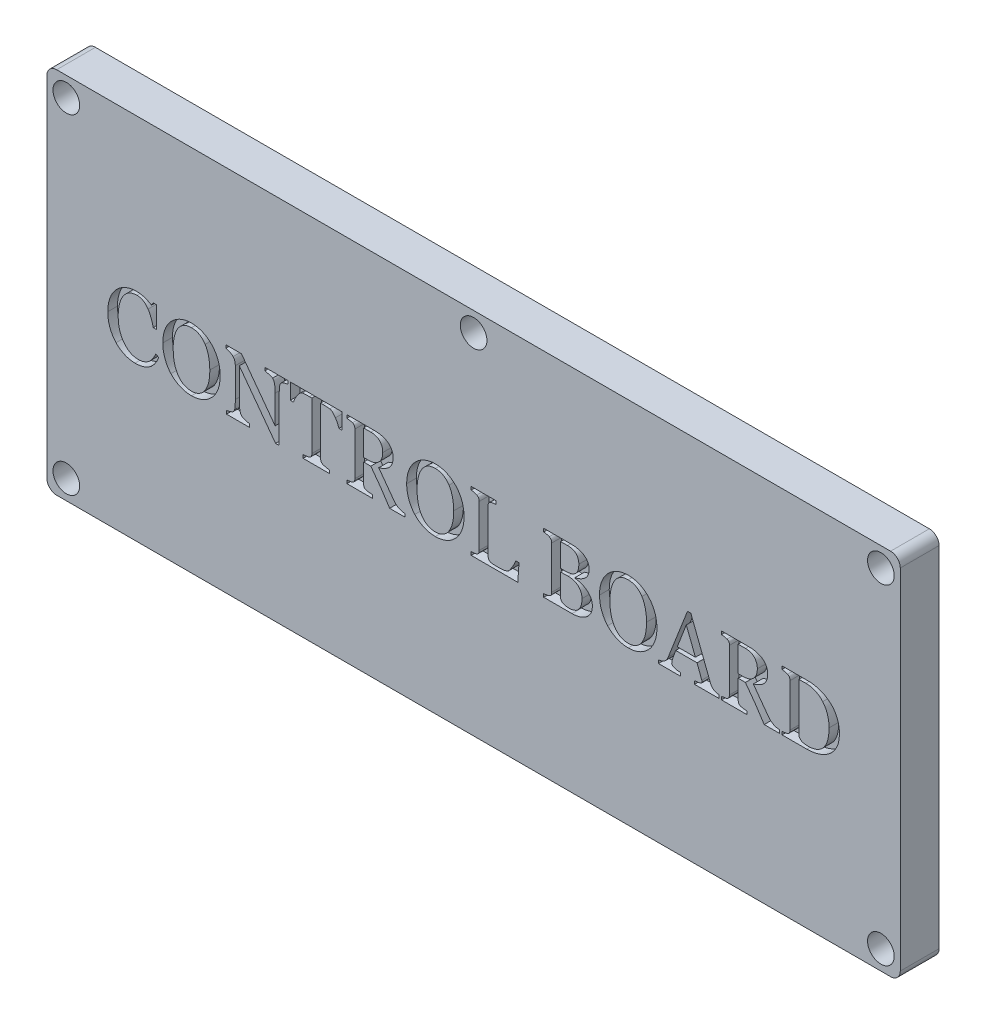
from build123d import *

# Parameters (mm, degrees)
SKETCH_1_W          = 176
SKETCH_1_H          = 76
EXTRUDE_1_DEPTH     = 8
SKETCH_2_R          = 1.6
CUT_EXTRUDE_1_DEPTH = 97.187317251
SKETCH_2_3_R        = 2.6
CUT_EXTRUDE_2_DEPTH = 3
SKETCH_4_R          = 2.75
CUT_EXTRUDE_3_DEPTH = 4
FILLET_1_R          = 2
CUT_EXTRUDE_4_DEPTH = 2


with BuildPart() as part:
    # 草图1 → 凸台-拉伸1 (new body)
    with BuildSketch(Plane.XY):
        Rectangle(SKETCH_1_W, SKETCH_1_H)
    extrude(amount=EXTRUDE_1_DEPTH)

    # 草图2 → 切除-拉伸1 (cut, through all)
    with BuildSketch(Plane(origin=(0, 0, 0), x_dir=(-1, 0, 0), z_dir=(0, 0, -1))):
        with Locations((-84, 34)):
            Circle(SKETCH_2_R)
        with Locations((-84, -34)):
            Circle(SKETCH_2_R)
        with Locations((0, 34)):
            Circle(SKETCH_2_R)
        with Locations((84, 34)):
            Circle(SKETCH_2_R)
        with Locations((84, -34)):
            Circle(SKETCH_2_R)
    extrude(amount=-CUT_EXTRUDE_1_DEPTH, mode=Mode.SUBTRACT)

    # 草图2<3> → 切除-拉伸2 (cut)
    with BuildSketch(Plane(origin=(0, 0, 0), x_dir=(-1, 0, 0), z_dir=(0, 0, -1))):
        with Locations((-84, 0)):
            Circle(SKETCH_2_3_R)
        with Locations((84, 0)):
            Circle(SKETCH_2_3_R)
        with Locations((0, -34)):
            Circle(SKETCH_2_3_R)
    extrude(amount=-CUT_EXTRUDE_2_DEPTH, mode=Mode.SUBTRACT)

    # 草图4 → 切除-拉伸3 (cut)
    with BuildSketch(Plane.XY.offset(8)):
        with Locations((-84, 34)):
            Circle(SKETCH_4_R)
        with Locations((0, 34)):
            Circle(SKETCH_4_R)
        with Locations((-84, -34)):
            Circle(SKETCH_4_R)
        with Locations((84, 34)):
            Circle(SKETCH_4_R)
        with Locations((84, -34)):
            Circle(SKETCH_4_R)
    extrude(amount=-CUT_EXTRUDE_3_DEPTH, mode=Mode.SUBTRACT)

    # 圆角1
    fillet_1_edges = [part.edges().sort_by_distance(p)[0] for p in [
        (88, 38, 4),
        (88, -38, 4),
        (-88, -38, 4),
        (-88, 38, 4),
    ]]
    fillet(fillet_1_edges, radius=FILLET_1_R)

    # 草图5 → 切除-拉伸4 (cut)
    # profile 1 of 12: a face of its own
    with BuildSketch(Plane.XY.offset(8)):
        with BuildLine():
            add(Edge.make_bspline(
                [(-69.842858317, -6.328744792), (-70.025523162, -6.323232146), (-70.388423385, -6.312280174), (-70.926266174, -6.226649969), (-71.452018788, -6.090616381), (-71.963898861, -5.900865711), (-72.45347952, -5.656144169), (-72.918418744, -5.364466568), (-73.356451953, -5.025148903), (-73.61921199, -4.763269173), (-73.751839355, -4.631086141)],
                knots=[0, 0, 0, 0, 1.000357293, 1.987409691, 2.97598758, 3.971793437, 4.97232664, 5.969148176, 6.974933442, 8, 8, 8, 8], degree=3))
            add(Edge.make_bspline(
                [(-73.751839355, -4.631086141), (-73.87739855, -4.488915093), (-74.131483179, -4.201214316), (-74.459441278, -3.716564532), (-74.745831174, -3.186740472), (-74.999878732, -2.617905909), (-75.200133933, -2.004472197), (-75.342481365, -1.351477595), (-75.432332596, -0.661253891), (-75.441993642, -0.188177982), (-75.446929687, 0.05352714)],
                knots=[0, 0, 0, 0, 0.891678765, 1.804422757, 2.74531323, 3.7227293, 4.731510067, 5.775203407, 6.863301384, 8, 8, 8, 8], degree=3))
            add(Edge.make_bspline(
                [(-75.446929687, 0.05352714), (-75.441640983, 0.296040957), (-75.431272806, 0.77147425), (-75.345943422, 1.467300801), (-75.201037679, 2.127810395), (-75.005057366, 2.753987422), (-74.751534769, 3.338370515), (-74.458520787, 3.884781051), (-74.119882175, 4.388907025), (-73.858511447, 4.692625978), (-73.728724487, 4.843441488)],
                knots=[0, 0, 0, 0, 1.117259419, 2.190317786, 3.224101329, 4.229695938, 5.208707492, 6.154809315, 7.083747094, 8, 8, 8, 8], degree=3))
            add(Edge.make_bspline(
                [(-73.728724487, 4.843441488), (-73.592737362, 4.982429941), (-73.321647496, 5.259502944), (-72.86715006, 5.623463828), (-72.372449077, 5.930792299), (-71.848390541, 6.194573967), (-71.295814657, 6.402333195), (-70.720238408, 6.547766442), (-70.127649528, 6.642269743), (-69.725077884, 6.651841617), (-69.521818481, 6.656674479)],
                knots=[0, 0, 0, 0, 0.989097946, 1.971763355, 2.954660603, 3.948498318, 4.953705294, 5.952431397, 6.966177633, 8, 8, 8, 8], degree=3))
            add(Edge.make_bspline(
                [(-69.521818481, 6.656674479), (-69.371840492, 6.654152372), (-69.07875291, 6.64922366), (-68.650441465, 6.597927259), (-68.243184924, 6.52113279), (-67.858527121, 6.40438934), (-67.488686663, 6.267178207), (-67.12935784, 6.109533894), (-66.776921022, 5.936443483), (-66.550421651, 5.805300664), (-66.437267741, 5.739784709)],
                knots=[0, 0, 0, 0, 1.103518468, 2.156500163, 3.171219252, 4.150321603, 5.111430575, 6.073840366, 7.037734658, 8, 8, 8, 8], degree=3))
            Line((-66.437267741, 5.739784709), (-66.077703125, 6.327929687))
            Line((-66.077703125, 6.327929687), (-65.420213542, 6.327929687))
            Line((-65.420213542, 6.327929687), (-65.420213542, 1.889875))
            Line((-65.420213542, 1.889875), (-66.077703125, 1.889875))
            add(Edge.make_bspline(
                [(-66.077703125, 1.889875), (-66.102407846, 2.004825934), (-66.152990848, 2.240188367), (-66.24977365, 2.597894749), (-66.362465458, 2.969738056), (-66.491340846, 3.348522953), (-66.631798923, 3.720550263), (-66.784370703, 4.07121278), (-66.95328841, 4.390367039), (-67.079718937, 4.586561665), (-67.140987061, 4.68163741)],
                knots=[0, 0, 0, 0, 0.939227178, 1.923070884, 2.959503962, 4.043159808, 5.119103628, 6.135826742, 7.096623258, 8, 8, 8, 8], degree=3))
            add(Edge.make_bspline(
                [(-67.140987061, 4.68163741), (-67.210641453, 4.781020019), (-67.347135248, 4.97576882), (-67.587660307, 5.233546073), (-67.843457775, 5.461015916), (-68.120914879, 5.652784449), (-68.417078388, 5.809318263), (-68.736259005, 5.920610513), (-69.076607213, 5.985292645), (-69.310083332, 5.99448752), (-69.429359009, 5.999184896)],
                knots=[0, 0, 0, 0, 1.055320811, 2.067992224, 3.060722848, 4.030272362, 4.996953381, 5.968019763, 6.961924587, 8, 8, 8, 8], degree=3))
            add(Edge.make_bspline(
                [(-69.429359009, 5.999184896), (-69.56755194, 5.995210734), (-69.839887094, 5.987378901), (-70.240419492, 5.910752618), (-70.627032251, 5.794742262), (-70.99630776, 5.625077048), (-71.34629075, 5.412318805), (-71.672402383, 5.151957514), (-71.975353335, 4.84851749), (-72.150135854, 4.617085166), (-72.23909965, 4.499286784)],
                knots=[0, 0, 0, 0, 0.99972128, 1.970138739, 2.9428508, 3.916708135, 4.904497039, 5.901793162, 6.932018805, 8, 8, 8, 8], degree=3))
            add(Edge.make_bspline(
                [(-72.23909965, 4.499286784), (-72.320559076, 4.373279555), (-72.488980803, 4.112752857), (-72.696395956, 3.678106517), (-72.879208497, 3.19685815), (-73.033370061, 2.670320199), (-73.160132133, 2.104496565), (-73.244515355, 1.503209557), (-73.300600934, 0.871318652), (-73.306879588, 0.438902777), (-73.310088542, 0.217899536)],
                knots=[0, 0, 0, 0, 0.803822747, 1.661946593, 2.575826641, 3.562009828, 4.601096665, 5.681958049, 6.815272952, 8, 8, 8, 8], degree=3))
            add(Edge.make_bspline(
                [(-73.310088542, 0.217899536), (-73.307018358, 0.021703719), (-73.30099866, -0.362976726), (-73.24251812, -0.926765995), (-73.150753919, -1.465861768), (-73.023142483, -1.979679336), (-72.859205764, -2.466045708), (-72.659699949, -2.922032707), (-72.433651873, -3.351222517), (-72.253621621, -3.614739083), (-72.164618408, -3.745016195)],
                knots=[0, 0, 0, 0, 1.122711024, 2.201295538, 3.240557286, 4.250796368, 5.228627743, 6.174515207, 7.097518275, 8, 8, 8, 8], degree=3))
            add(Edge.make_bspline(
                [(-72.164618408, -3.745016195), (-72.071481254, -3.865568578), (-71.887558577, -4.103629505), (-71.567377408, -4.41464215), (-71.23103241, -4.694787213), (-70.864454453, -4.925503015), (-70.475001745, -5.113097297), (-70.061346243, -5.246540194), (-69.625277218, -5.32913391), (-69.326997122, -5.337996876), (-69.175095459, -5.342510417)],
                knots=[0, 0, 0, 0, 1.036417804, 2.04666698, 3.033020796, 4.013392149, 4.988912774, 5.969977607, 6.96619392, 8, 8, 8, 8], degree=3))
            add(Edge.make_bspline(
                [(-69.175095459, -5.342510417), (-69.061132466, -5.339174975), (-68.837598897, -5.332632647), (-68.50864114, -5.292200142), (-68.194711784, -5.218552552), (-67.893774775, -5.122928191), (-67.612678765, -4.996999151), (-67.346075612, -4.860215061), (-67.100531176, -4.700128484), (-66.950785838, -4.578472024), (-66.876450236, -4.518080119)],
                knots=[0, 0, 0, 0, 1.096995525, 2.151710122, 3.18308967, 4.19670752, 5.1856096, 6.143863005, 7.078588598, 8, 8, 8, 8], degree=3))
            add(Edge.make_bspline(
                [(-66.876450236, -4.518080119), (-66.737101925, -4.383061794), (-66.456983911, -4.111647919), (-66.167417272, -3.714975545), (-65.958324434, -3.378602476), (-65.818763626, -3.111652144), (-65.690380287, -2.8356219), (-65.62007602, -2.644605894), (-65.584585937, -2.548179688)],
                knots=[0, 0, 0, 0, 1.465493107, 2.945934656, 3.699004642, 4.460905754, 5.223054536, 6, 6, 6, 6], degree=3))
            Line((-65.584585937, -2.548179688), (-64.927096354, -2.866651204))
            add(Edge.make_bspline(
                [(-64.927096354, -2.866651204), (-64.990581405, -3.017167664), (-65.114334186, -3.310572649), (-65.322043106, -3.728838539), (-65.548970026, -4.11109027), (-65.786952096, -4.463581868), (-66.044572894, -4.779293417), (-66.315543712, -5.06390988), (-66.599789443, -5.317471311), (-66.903771725, -5.533881629), (-67.220626051, -5.721550473), (-67.552192555, -5.884375156), (-67.897642924, -6.023567727), (-68.259256493, -6.132812835), (-68.634039517, -6.220787239), (-69.023377108, -6.285478055), (-69.428698389, -6.320801124), (-69.703248707, -6.326067052), (-69.842858317, -6.328744792)],
                knots=[0, 0, 0, 0, 1.214436643, 2.367327582, 3.468817088, 4.517545727, 5.526579746, 6.494543457, 7.437057883, 8.353858559, 9.264295335, 10.172392712, 11.097902399, 12.030129511, 12.978130447, 13.958653759, 14.961969684, 16, 16, 16, 16], degree=3))
        make_face()
    # profile 2 of 12: a face of its own
    with BuildSketch(Plane.XY.offset(8)):
        with BuildLine():
            add(Edge.make_bspline(
                [(-54.006605306, 4.892239543), (-53.874859143, 4.745106593), (-53.60960789, 4.44887634), (-53.268661096, 3.949956307), (-52.969877165, 3.409225841), (-52.718522957, 2.825263505), (-52.518128466, 2.203701448), (-52.375287404, 1.54749563), (-52.285185835, 0.85992029), (-52.275403021, 0.390261117), (-52.270421875, 0.15112325)],
                knots=[0, 0, 0, 0, 0.915570089, 1.843363841, 2.796351829, 3.778506709, 4.78850275, 5.821698104, 6.890867042, 8, 8, 8, 8], degree=3))
            add(Edge.make_bspline(
                [(-52.270421875, 0.15112325), (-52.2750561, -0.089767868), (-52.284127934, -0.561329933), (-52.378590738, -1.251203277), (-52.521792152, -1.908252358), (-52.728967847, -2.528448026), (-52.985227326, -3.108523349), (-53.286811027, -3.647344642), (-53.635737173, -4.141728869), (-53.905776507, -4.436018222), (-54.039993449, -4.582288086)],
                knots=[0, 0, 0, 0, 1.115004608, 2.182703448, 3.218717185, 4.225541562, 5.205422103, 6.15165086, 7.081319879, 8, 8, 8, 8], degree=3))
            add(Edge.make_bspline(
                [(-54.039993449, -4.582288086), (-54.176769425, -4.717229629), (-54.448839097, -4.985650315), (-54.905385275, -5.332404334), (-55.393627305, -5.631716243), (-55.911032435, -5.883433899), (-56.454459463, -6.080852802), (-57.015679506, -6.225776043), (-57.596092812, -6.312924014), (-57.988915032, -6.323426603), (-58.187828125, -6.328744792)],
                knots=[0, 0, 0, 0, 0.996249321, 1.981702003, 2.966914307, 3.964381325, 4.962263802, 5.962220984, 6.968131369, 8, 8, 8, 8], degree=3))
            add(Edge.make_bspline(
                [(-58.187828125, -6.328744792), (-58.397883942, -6.322739938), (-58.812247386, -6.310894555), (-59.421268701, -6.219448963), (-60.005379698, -6.066755417), (-60.563296169, -5.857435499), (-61.087032414, -5.587917154), (-61.577755203, -5.275203356), (-62.029001138, -4.911069271), (-62.296474668, -4.633997493), (-62.430690592, -4.494965251)],
                knots=[0, 0, 0, 0, 1.058596254, 2.088223952, 3.096244063, 4.097367337, 5.085561236, 6.060014263, 7.026531786, 8, 8, 8, 8], degree=3))
            add(Edge.make_bspline(
                [(-62.430690592, -4.494965251), (-62.557423917, -4.348667953), (-62.81286028, -4.053799576), (-63.137326586, -3.555940493), (-63.427104797, -3.018369807), (-63.668477042, -2.436263223), (-63.86423883, -1.82232876), (-64.001231562, -1.182293876), (-64.089698147, -0.522536969), (-64.100015399, -0.075174702), (-64.105234375, 0.15112325)],
                knots=[0, 0, 0, 0, 0.918904815, 1.852091434, 2.816806551, 3.817971808, 4.842200091, 5.87483003, 6.924983962, 8, 8, 8, 8], degree=3))
            add(Edge.make_bspline(
                [(-64.105234375, 0.15112325), (-64.100724001, 0.396311812), (-64.091923128, 0.874736348), (-63.996761122, 1.571081636), (-63.858432289, 2.229258939), (-63.648815161, 2.843521771), (-63.392686985, 3.418136824), (-63.08732906, 3.950438832), (-62.744269041, 4.447878472), (-62.476854894, 4.744281705), (-62.343367757, 4.892239543)],
                knots=[0, 0, 0, 0, 1.133978211, 2.212676634, 3.247069858, 4.241878549, 5.210179397, 6.154215519, 7.078625832, 8, 8, 8, 8], degree=3))
            add(Edge.make_bspline(
                [(-62.343367757, 4.892239543), (-62.205022555, 5.029908566), (-61.930240173, 5.303347915), (-61.467511985, 5.654756451), (-60.975677667, 5.960401514), (-60.451532245, 6.211180647), (-59.904672646, 6.408025705), (-59.343641478, 6.553187832), (-58.769305096, 6.640527042), (-58.382460821, 6.651269589), (-58.187828125, 6.656674479)],
                knots=[0, 0, 0, 0, 1.008630087, 2.003349393, 2.997595409, 3.999847191, 5.002861818, 5.999619617, 6.99354998, 8, 8, 8, 8], degree=3))
            add(Edge.make_bspline(
                [(-58.187828125, 6.656674479), (-57.986302683, 6.651627841), (-57.587308874, 6.641636161), (-56.998983189, 6.550201296), (-56.42775862, 6.407769626), (-55.87902368, 6.203067191), (-55.354816943, 5.95054187), (-54.86572192, 5.6458128), (-54.411112802, 5.296246494), (-54.14167577, 5.027142868), (-54.006605306, 4.892239543)],
                knots=[0, 0, 0, 0, 1.035965556, 2.051075242, 3.055015342, 4.059534728, 5.058051958, 6.042950296, 7.018918787, 8, 8, 8, 8], degree=3))
        make_face()
        with BuildLine():
            add(Edge.make_bspline(
                [(-55.32672111, -3.860590535), (-55.250015718, -3.72563764), (-55.095447327, -3.453695194), (-54.901968937, -3.019349947), (-54.746795125, -2.557637862), (-54.621116201, -2.069865036), (-54.52392582, -1.555040274), (-54.455528807, -1.012131172), (-54.413577502, -0.44025883), (-54.409402825, -0.049279921), (-54.407263021, 0.15112325)],
                knots=[0, 0, 0, 0, 0.893655072, 1.80079683, 2.733220172, 3.695918186, 4.699685548, 5.748531072, 6.84596969, 8, 8, 8, 8], degree=3))
            add(Edge.make_bspline(
                [(-54.407263021, 0.15112325), (-54.410098802, 0.35753472), (-54.415660092, 0.762331134), (-54.462915234, 1.356560225), (-54.539039236, 1.925248463), (-54.646212297, 2.465712579), (-54.781696538, 2.974794457), (-54.943550148, 3.447711465), (-55.139293264, 3.880631452), (-55.294500885, 4.14606937), (-55.370382528, 4.275843058)],
                knots=[0, 0, 0, 0, 1.155043419, 2.265171773, 3.333744221, 4.364526278, 5.346587502, 6.279979449, 7.159074886, 8, 8, 8, 8], degree=3))
            add(Edge.make_bspline(
                [(-55.370382528, 4.275843058), (-55.451460884, 4.394440303), (-55.610592122, 4.627209285), (-55.89573139, 4.936156243), (-56.209841344, 5.203917958), (-56.552823049, 5.432083817), (-56.923906382, 5.612852177), (-57.3221731, 5.742164632), (-57.746392485, 5.820900785), (-58.038522461, 5.830107176), (-58.187828125, 5.8348125)],
                knots=[0, 0, 0, 0, 1.023011571, 2.007849017, 2.986198337, 3.959452302, 4.936582685, 5.918902063, 6.936364857, 8, 8, 8, 8], degree=3))
            add(Edge.make_bspline(
                [(-58.187828125, 5.8348125), (-58.353416283, 5.828758043), (-58.674184423, 5.817029688), (-59.137471861, 5.730401454), (-59.560416574, 5.57711919), (-59.943907576, 5.366361596), (-60.289647472, 5.106696919), (-60.60204238, 4.805512751), (-60.88519944, 4.466914878), (-61.040014133, 4.213765552), (-61.118279744, 4.085787476)],
                knots=[0, 0, 0, 0, 1.106812517, 2.144055442, 3.136259835, 4.101942646, 5.05895253, 6.018372785, 6.998200614, 8, 8, 8, 8], degree=3))
            add(Edge.make_bspline(
                [(-61.118279744, 4.085787476), (-61.187269082, 3.954142022), (-61.327949037, 3.685696528), (-61.501359616, 3.253898531), (-61.647991915, 2.790248192), (-61.763317516, 2.296005495), (-61.855924836, 1.780813022), (-61.918065539, 1.248928697), (-61.962109084, 0.704907156), (-61.966284085, 0.336989398), (-61.968393229, 0.15112325)],
                knots=[0, 0, 0, 0, 0.876691038, 1.787708964, 2.741651199, 3.744079983, 4.780747401, 5.829179856, 6.903336499, 8, 8, 8, 8], degree=3))
            add(Edge.make_bspline(
                [(-61.968393229, 0.15112325), (-61.9665619, -0.051869509), (-61.9629874, -0.448083204), (-61.916704448, -1.027400231), (-61.849380575, -1.577271213), (-61.752776397, -2.097636947), (-61.624217311, -2.58788239), (-61.465280599, -3.049584212), (-61.273898234, -3.483544199), (-61.118145256, -3.753139971), (-61.041230184, -3.886273722)],
                knots=[0, 0, 0, 0, 1.161090735, 2.266287984, 3.322775518, 4.329531603, 5.291841248, 6.219691012, 7.120834829, 8, 8, 8, 8], degree=3))
            add(Edge.make_bspline(
                [(-61.041230184, -3.886273722), (-60.961896889, -4.008212305), (-60.805713926, -4.248272029), (-60.524884816, -4.568369513), (-60.215013891, -4.84711423), (-59.876973663, -5.087149906), (-59.503149, -5.277609589), (-59.093683582, -5.408625041), (-58.652025087, -5.495061825), (-58.34578522, -5.502860363), (-58.187828125, -5.506882813)],
                knots=[0, 0, 0, 0, 1.012879785, 1.994050099, 2.957350163, 3.912503271, 4.875821815, 5.868320498, 6.900489659, 8, 8, 8, 8], degree=3))
            add(Edge.make_bspline(
                [(-58.187828125, -5.506882813), (-58.037666993, -5.501261082), (-57.743731997, -5.490256748), (-57.31373047, -5.409248388), (-56.908460325, -5.271533226), (-56.525784147, -5.083923094), (-56.17347857, -4.843690419), (-55.854112943, -4.558473326), (-55.563096806, -4.233724476), (-55.406385334, -3.986345536), (-55.32672111, -3.860590535)],
                knots=[0, 0, 0, 0, 1.041516606, 2.038731167, 3.022983239, 4.003194371, 4.986729267, 5.971303897, 6.968713028, 8, 8, 8, 8], degree=3))
        make_face(mode=Mode.SUBTRACT)
    # profile 3 of 12: a face of its own
    with BuildSketch(Plane.XY.offset(8)):
        with BuildLine():
            add(Edge.make_bspline(
                [(-38.298768229, 5.670440104), (-38.340837442, 5.667948984), (-38.435104898, 5.662366956), (-38.589468353, 5.629576661), (-38.774480545, 5.590711044), (-38.976951799, 5.532513427), (-39.178839804, 5.469872857), (-39.358044199, 5.403405093), (-39.507311441, 5.339595543), (-39.58947236, 5.286199416), (-39.626588989, 5.262077433)],
                knots=[0, 0, 0, 0, 0.721636794, 1.617022543, 2.699651884, 3.963875089, 5.226563525, 6.322642193, 7.242244757, 8, 8, 8, 8], degree=3))
            add(Edge.make_bspline(
                [(-39.626588989, 5.262077433), (-39.672968584, 5.219738386), (-39.772108146, 5.12923577), (-39.872461079, 4.93403648), (-39.957679081, 4.698849023), (-40.015191409, 4.413818831), (-40.057870249, 4.085976719), (-40.082743041, 3.714477893), (-40.106052238, 3.302736719), (-40.106585986, 3.01398545), (-40.106864583, 2.863267782)],
                knots=[0, 0, 0, 0, 0.597115289, 1.276374863, 2.069944957, 2.992955396, 4.051532198, 5.23550416, 6.557033648, 8, 8, 8, 8], degree=3))
            Line((-40.106864583, 2.863267782), (-40.106864583, -6.164372396))
            Line((-40.106864583, -6.164372396), (-40.843972046, -6.164372396))
            Line((-40.843972046, -6.164372396), (-48.325484375, 3.957371541))
            Line((-48.325484375, 3.957371541), (-48.325484375, -2.36839738))
            add(Edge.make_bspline(
                [(-48.325484375, -2.36839738), (-48.324471974, -2.535380302), (-48.322570364, -2.84902722), (-48.296785344, -3.288654967), (-48.257536267, -3.667016843), (-48.202604674, -3.987786961), (-48.128751039, -4.257885431), (-48.035217207, -4.482815088), (-47.931987186, -4.673718249), (-47.837955677, -4.770569148), (-47.793842407, -4.816005086)],
                knots=[0, 0, 0, 0, 1.564392426, 2.938425413, 4.124561296, 5.126873188, 5.985219305, 6.740483808, 7.409119581, 8, 8, 8, 8], degree=3))
            add(Edge.make_bspline(
                [(-47.793842407, -4.816005086), (-47.753716197, -4.848307149), (-47.662443275, -4.921782904), (-47.482696408, -5.007137148), (-47.256030126, -5.094026972), (-46.994095551, -5.171941366), (-46.732023442, -5.238912804), (-46.505398699, -5.292922456), (-46.330109573, -5.33016313), (-46.229832293, -5.338915405), (-46.188643229, -5.342510417)],
                knots=[0, 0, 0, 0, 0.72261565, 1.64369474, 2.779885142, 4.139958371, 5.483669464, 6.584983551, 7.418779589, 8, 8, 8, 8], degree=3))
            Line((-46.188643229, -5.342510417), (-46.188643229, -6))
            Line((-46.188643229, -6), (-50.955442708, -6))
            Line((-50.955442708, -6), (-50.955442708, -5.342510417))
            add(Edge.make_bspline(
                [(-50.955442708, -5.342510417), (-50.914260829, -5.337035401), (-50.819297838, -5.324410336), (-50.660235038, -5.28890026), (-50.46468702, -5.240343797), (-50.247034753, -5.177115234), (-50.034297918, -5.107460147), (-49.853966403, -5.040163099), (-49.718975209, -4.975473217), (-49.651070577, -4.924701065), (-49.622485311, -4.903327922)],
                knots=[0, 0, 0, 0, 0.705029105, 1.625755647, 2.76436342, 4.125947264, 5.472632914, 6.563097854, 7.395118884, 8, 8, 8, 8], degree=3))
            add(Edge.make_bspline(
                [(-49.622485311, -4.903327922), (-49.578438838, -4.859638163), (-49.487297928, -4.769235366), (-49.386854796, -4.593963398), (-49.304901408, -4.391805943), (-49.253420466, -4.19985786), (-49.226151947, -4.023393762), (-49.200377626, -3.867288019), (-49.18849621, -3.687627625), (-49.170729372, -3.487583069), (-49.163187108, -3.263860567), (-49.149871914, -3.019176973), (-49.150519668, -2.751913924), (-49.148429923, -2.567007327), (-49.147346354, -2.471130127)],
                knots=[0, 0, 0, 0, 0.875884541, 1.812379285, 2.835440708, 3.965725206, 4.61806958, 5.366297751, 6.206749643, 7.168149523, 8.212859411, 9.378798593, 10.640862697, 12, 12, 12, 12], degree=3))
            Line((-49.147346354, -2.471130127), (-49.147346354, 3.556713826))
            add(Edge.make_bspline(
                [(-49.147346354, 3.556713826), (-49.153306954, 3.6899425), (-49.165331215, 3.958703402), (-49.245986927, 4.285770124), (-49.332260086, 4.533573383), (-49.409631707, 4.700145768), (-49.497451902, 4.844400469), (-49.568307065, 4.925607305), (-49.601938761, 4.964152466)],
                knots=[0, 0, 0, 0, 1.587732995, 3.202918242, 3.994333894, 4.716204477, 5.390641143, 6, 6, 6, 6], degree=3))
            add(Edge.make_bspline(
                [(-49.601938761, 4.964152466), (-49.651438646, 5.010743348), (-49.753250617, 5.106572046), (-49.931522071, 5.231572641), (-50.131235602, 5.350971201), (-50.351957944, 5.450376725), (-50.569730047, 5.537652745), (-50.77238552, 5.606543135), (-50.952822057, 5.652101162), (-51.067411515, 5.664685216), (-51.119815104, 5.670440104)],
                knots=[0, 0, 0, 0, 0.958113034, 1.970658632, 3.064610846, 4.237432849, 5.381531405, 6.374795584, 7.256768056, 8, 8, 8, 8], degree=3))
            Line((-51.119815104, 5.670440104), (-51.119815104, 6.327929687))
            Line((-51.119815104, 6.327929687), (-47.881165243, 6.327929687))
            Line((-47.881165243, 6.327929687), (-40.928726562, -3.079821655))
            Line((-40.928726562, -3.079821655), (-40.928726562, 2.763103353))
            add(Edge.make_bspline(
                [(-40.928726562, 2.763103353), (-40.929829307, 2.931791837), (-40.931901957, 3.248847997), (-40.956588958, 3.692924669), (-40.998931636, 4.074739645), (-41.057207697, 4.396738188), (-41.129175228, 4.666028742), (-41.222124671, 4.882580308), (-41.323555418, 5.058298792), (-41.415432546, 5.139758895), (-41.457800212, 5.177322917)],
                knots=[0, 0, 0, 0, 1.597899814, 3.003310992, 4.211516956, 5.234338353, 6.102170457, 6.84335817, 7.466633144, 8, 8, 8, 8], degree=3))
            add(Edge.make_bspline(
                [(-41.457800212, 5.177322917), (-41.503422777, 5.205857901), (-41.604025442, 5.268780611), (-41.784293252, 5.34502983), (-41.999044535, 5.424864746), (-42.240999679, 5.496815413), (-42.484313839, 5.563061389), (-42.706271152, 5.618904574), (-42.896983275, 5.652976148), (-43.013271761, 5.665022676), (-43.065567708, 5.670440104)],
                knots=[0, 0, 0, 0, 0.761894269, 1.680058823, 2.7668661, 4.010876332, 5.256425229, 6.342757932, 7.254723768, 8, 8, 8, 8], degree=3))
            Line((-43.065567708, 5.670440104), (-43.065567708, 6.327929687))
            Line((-43.065567708, 6.327929687), (-38.298768229, 6.327929687))
            Line((-38.298768229, 6.327929687), (-38.298768229, 5.670440104))
        make_face()
    # profile 4 of 12: a face of its own
    with BuildSketch(Plane.XY.offset(8)):
        with BuildLine():
            Line((-27.121445312, 3.040481771), (-27.778934896, 3.040481771))
            add(Edge.make_bspline(
                [(-27.778934896, 3.040481771), (-27.79364331, 3.094633669), (-27.824539496, 3.208384011), (-27.888034049, 3.383585461), (-27.96522353, 3.573736632), (-28.088219232, 3.845792928), (-28.261619184, 4.186255686), (-28.425042634, 4.445639792), (-28.505769084, 4.573768026)],
                knots=[0, 0, 0, 0, 0.592804253, 1.245232173, 1.967677556, 2.761390378, 4.400220664, 6, 6, 6, 6], degree=3))
            add(Edge.make_bspline(
                [(-28.505769084, 4.573768026), (-28.591633587, 4.699565996), (-28.758920732, 4.944654276), (-29.008093393, 5.209773412), (-29.20590665, 5.395674347), (-29.356221821, 5.494812378), (-29.501514685, 5.570752091), (-29.602580217, 5.591234191), (-29.651239217, 5.6010955)],
                knots=[0, 0, 0, 0, 1.736489452, 3.383148476, 4.144668783, 4.827936634, 5.435698507, 6, 6, 6, 6], degree=3))
            add(Edge.make_bspline(
                [(-29.651239217, 5.6010955), (-29.751319516, 5.612393408), (-29.974121717, 5.637545199), (-30.326601157, 5.653146861), (-30.697299427, 5.666720417), (-30.944801578, 5.669232266), (-31.063814494, 5.670440104)],
                knots=[0, 0, 0, 0, 0.853923529, 1.901033896, 2.990699373, 4, 4, 4, 4], degree=3))
            Line((-31.063814494, 5.670440104), (-31.5595, 5.670440104))
            Line((-31.5595, 5.670440104), (-31.5595, -4.171357096))
            add(Edge.make_bspline(
                [(-31.5595, -4.171357096), (-31.553831048, -4.263416397), (-31.542728818, -4.443707827), (-31.475562474, -4.660508006), (-31.384607265, -4.811523748), (-31.296965511, -4.912611683), (-31.186542478, -4.998773215), (-31.102286825, -5.042499952), (-31.058677856, -5.065131999)],
                knots=[0, 0, 0, 0, 1.524414483, 2.985454663, 3.697597447, 4.4308618, 5.187846798, 6, 6, 6, 6], degree=3))
            add(Edge.make_bspline(
                [(-31.058677856, -5.065131999), (-31.02886598, -5.076717916), (-30.956607397, -5.104800078), (-30.825824385, -5.139768499), (-30.658357703, -5.188712339), (-30.460539055, -5.232557479), (-30.256435141, -5.27793023), (-30.065435505, -5.311959735), (-29.89989556, -5.33288422), (-29.797670411, -5.339511109), (-29.751403646, -5.342510417)],
                knots=[0, 0, 0, 0, 0.572401551, 1.387397582, 2.421413878, 3.696927827, 5.013963675, 6.16582816, 7.169859891, 8, 8, 8, 8], degree=3))
            Line((-29.751403646, -5.342510417), (-29.751403646, -6))
            Line((-29.751403646, -6), (-35.175692708, -6))
            Line((-35.175692708, -6), (-35.175692708, -5.342510417))
            add(Edge.make_bspline(
                [(-35.175692708, -5.342510417), (-35.133730621, -5.339233701), (-35.040301315, -5.331938037), (-34.886204548, -5.316249639), (-34.703215278, -5.29454844), (-34.50076387, -5.274325829), (-34.300925657, -5.24815772), (-34.126294025, -5.217183515), (-33.985632053, -5.187504898), (-33.907516211, -5.155915246), (-33.873555135, -5.142181559)],
                knots=[0, 0, 0, 0, 0.764519304, 1.702215315, 2.813302155, 4.111576634, 5.398156815, 6.471944093, 7.335673518, 8, 8, 8, 8], degree=3))
            add(Edge.make_bspline(
                [(-33.873555135, -5.142181559), (-33.831437185, -5.123343459), (-33.750078153, -5.086953995), (-33.648249305, -5.006066147), (-33.556595751, -4.921906887), (-33.487070295, -4.818422125), (-33.432146949, -4.700699678), (-33.394832984, -4.566184567), (-33.37120078, -4.414467359), (-33.368844256, -4.307578315), (-33.367596354, -4.250974976)],
                knots=[0, 0, 0, 0, 1.005391946, 1.942110586, 2.829771978, 3.718421307, 4.648748454, 5.662657141, 6.762254711, 8, 8, 8, 8], degree=3))
            Line((-33.367596354, -4.250974976), (-33.367596354, 5.670440104))
            Line((-33.367596354, 5.670440104), (-33.86328186, 5.670440104))
            add(Edge.make_bspline(
                [(-33.86328186, 5.670440104), (-33.962597964, 5.669975024), (-34.182678584, 5.668944423), (-34.531181331, 5.658185153), (-34.903328252, 5.641419176), (-35.153533779, 5.614336157), (-35.275857137, 5.6010955)],
                knots=[0, 0, 0, 0, 0.842200905, 1.866284426, 2.956844574, 4, 4, 4, 4], degree=3))
            add(Edge.make_bspline(
                [(-35.275857137, 5.6010955), (-35.323487039, 5.591807098), (-35.423916715, 5.572222109), (-35.571535902, 5.502289168), (-35.718680498, 5.39577724), (-35.919922618, 5.211670137), (-36.161824348, 4.938258957), (-36.333608437, 4.696975576), (-36.421327271, 4.573768026)],
                knots=[0, 0, 0, 0, 0.552302759, 1.164553878, 1.845065974, 2.620125537, 4.274120453, 6, 6, 6, 6], degree=3))
            add(Edge.make_bspline(
                [(-36.421327271, 4.573768026), (-36.503990221, 4.442334554), (-36.670470242, 4.177632569), (-36.843762914, 3.830574582), (-36.964231144, 3.556479872), (-37.038162263, 3.368357184), (-37.101650789, 3.199619665), (-37.133342078, 3.091186801), (-37.148161458, 3.040481771)],
                knots=[0, 0, 0, 0, 1.640837548, 3.304584065, 4.094980771, 4.80597779, 5.441655132, 6, 6, 6, 6], degree=3))
            Line((-37.148161458, 3.040481771), (-37.805651042, 3.040481771))
            Line((-37.805651042, 3.040481771), (-37.805651042, 6.327929687))
            Line((-37.805651042, 6.327929687), (-27.121445312, 6.327929687))
            Line((-27.121445312, 6.327929687), (-27.121445312, 3.040481771))
        make_face()
    # profile 5 of 12: a face of its own
    with BuildSketch(Plane.XY.offset(8)):
        with BuildLine():
            Line((-14.136026042, -6), (-17.318172892, -6))
            add(Edge.make_bspline(
                [(-17.318172892, -6), (-17.494909452, -5.721461541), (-17.837414778, -5.181669965), (-18.341773426, -4.404051379), (-18.823325019, -3.686543802), (-19.284301859, -3.01580009), (-19.743716723, -2.370128782), (-20.208306446, -1.722711924), (-20.699064003, -1.070398415), (-21.032581968, -0.632887749), (-21.201470744, -0.411338542)],
                knots=[0, 0, 0, 0, 1.162875723, 2.253586525, 3.267222227, 4.208978507, 5.122537131, 6.060659723, 7.017945537, 8, 8, 8, 8], degree=3))
            Line((-21.201470744, -0.411338542), (-22.683390625, -0.411338542))
            Line((-22.683390625, -0.411338542), (-22.683390625, -4.289499756))
            add(Edge.make_bspline(
                [(-22.683390625, -4.289499756), (-22.678405575, -4.384847503), (-22.668934873, -4.565991118), (-22.609500452, -4.785121797), (-22.519982521, -4.933497944), (-22.422136228, -5.028503785), (-22.298618471, -5.110690041), (-22.202260808, -5.149885966), (-22.151748657, -5.170433065)],
                knots=[0, 0, 0, 0, 1.543294706, 2.931983115, 3.615997915, 4.320996238, 5.119840729, 6, 6, 6, 6], degree=3))
            add(Edge.make_bspline(
                [(-22.151748657, -5.170433065), (-22.119337839, -5.180319156), (-22.044182852, -5.203243262), (-21.914141608, -5.229146826), (-21.754081605, -5.257714059), (-21.510413117, -5.293524239), (-21.214209795, -5.326465819), (-20.980666062, -5.337522011), (-20.875294271, -5.342510417)],
                knots=[0, 0, 0, 0, 0.472293532, 1.095165645, 1.846920814, 2.740087426, 4.529171281, 6, 6, 6, 6], degree=3))
            Line((-20.875294271, -5.342510417), (-20.875294271, -6))
            Line((-20.875294271, -6), (-26.135210938, -6))
            Line((-26.135210938, -6), (-26.135210938, -5.342510417))
            add(Edge.make_bspline(
                [(-26.135210938, -5.342510417), (-26.096688273, -5.339067913), (-26.011923, -5.331493029), (-25.873056887, -5.31951806), (-25.711627386, -5.299497464), (-25.534824163, -5.284486634), (-25.361221771, -5.264158569), (-25.209537479, -5.233669504), (-25.085071283, -5.209776204), (-25.015173054, -5.182403907), (-24.984604167, -5.170433065)],
                knots=[0, 0, 0, 0, 0.795657397, 1.750764587, 2.867138215, 4.141169139, 5.401615559, 6.458619135, 7.325901416, 8, 8, 8, 8], degree=3))
            add(Edge.make_bspline(
                [(-24.984604167, -5.170433065), (-24.943773237, -5.150111262), (-24.865048064, -5.110929264), (-24.759155771, -5.035680808), (-24.674572346, -4.944651473), (-24.605209528, -4.841754751), (-24.5548307, -4.723763764), (-24.515351197, -4.593107312), (-24.496195225, -4.445860423), (-24.493112251, -4.34347498), (-24.491486979, -4.289499756)],
                knots=[0, 0, 0, 0, 1.014821994, 1.956654853, 2.873659688, 3.767181126, 4.705922198, 5.719310827, 6.797673726, 8, 8, 8, 8], degree=3))
            Line((-24.491486979, -4.289499756), (-24.491486979, 4.558358114))
            add(Edge.make_bspline(
                [(-24.491486979, 4.558358114), (-24.494635593, 4.653830758), (-24.500625457, 4.835456103), (-24.557321462, 5.052586704), (-24.630411778, 5.208343647), (-24.723379381, 5.303949377), (-24.84089304, 5.388629252), (-24.934728217, 5.42673966), (-24.984604167, 5.446996379)],
                knots=[0, 0, 0, 0, 1.559636857, 2.967023535, 3.643936534, 4.348153, 5.121998385, 6, 6, 6, 6], degree=3))
            add(Edge.make_bspline(
                [(-24.984604167, 5.446996379), (-25.067261439, 5.473312039), (-25.251760011, 5.532050993), (-25.548725405, 5.589007372), (-25.848699152, 5.644036172), (-26.046010673, 5.662219717), (-26.135210938, 5.670440104)],
                knots=[0, 0, 0, 0, 0.885538746, 1.976603263, 3.085266169, 4, 4, 4, 4], degree=3))
            Line((-26.135210938, 5.670440104), (-26.135210938, 6.327929687))
            Line((-26.135210938, 6.327929687), (-20.474636556, 6.327929687))
            add(Edge.make_bspline(
                [(-20.474636556, 6.327929687), (-20.347041922, 6.325678259), (-20.094966073, 6.321230339), (-19.722432371, 6.294315561), (-19.362694195, 6.241246768), (-19.014578136, 6.173666044), (-18.68118756, 6.081571885), (-18.36299823, 5.965740613), (-18.06110771, 5.824875549), (-17.872021348, 5.711475881), (-17.777901937, 5.655030192)],
                knots=[0, 0, 0, 0, 1.087147368, 2.147767399, 3.179247156, 4.183391507, 5.167252348, 6.122527352, 7.065471371, 8, 8, 8, 8], degree=3))
            add(Edge.make_bspline(
                [(-17.777901937, 5.655030192), (-17.691485732, 5.595515967), (-17.519159403, 5.476836052), (-17.290827223, 5.261180686), (-17.088807419, 5.020910007), (-16.915429156, 4.754050492), (-16.772459491, 4.461167328), (-16.672134171, 4.137451187), (-16.613134593, 3.785747658), (-16.605535345, 3.541537798), (-16.601611979, 3.415456299)],
                knots=[0, 0, 0, 0, 0.950713837, 1.895859989, 2.838545943, 3.792837654, 4.775866477, 5.785412781, 6.856645365, 8, 8, 8, 8], degree=3))
            add(Edge.make_bspline(
                [(-16.601611979, 3.415456299), (-16.603614676, 3.30058443), (-16.607499492, 3.077756833), (-16.650846503, 2.753958936), (-16.715323463, 2.449518643), (-16.812100168, 2.166474812), (-16.92956839, 1.900689146), (-17.077372853, 1.657366065), (-17.247761134, 1.429145274), (-17.381509217, 1.295064818), (-17.449157145, 1.227248779)],
                knots=[0, 0, 0, 0, 1.140441741, 2.212220404, 3.239864216, 4.226902188, 5.178532678, 6.120767702, 7.049510326, 8, 8, 8, 8], degree=3))
            add(Edge.make_bspline(
                [(-17.449157145, 1.227248779), (-17.515808152, 1.166150145), (-17.650530824, 1.042650567), (-17.874360377, 0.876181152), (-18.114810252, 0.71818873), (-18.470337943, 0.530313637), (-18.951397282, 0.318554722), (-19.356913395, 0.189327421), (-19.565451742, 0.122871745)],
                knots=[0, 0, 0, 0, 0.67505162, 1.36449189, 2.08115961, 2.822293603, 4.365851277, 6, 6, 6, 6], degree=3))
            add(Edge.make_bspline(
                [(-19.565451742, 0.122871745), (-19.419843802, -0.072268174), (-19.141016508, -0.445945157), (-18.742047849, -0.982936196), (-18.383072204, -1.473071679), (-18.050714372, -1.93071987), (-17.720576678, -2.387022893), (-17.366573383, -2.8712678), (-16.978071234, -3.400694713), (-16.708581429, -3.768955018), (-16.568223836, -3.960754964)],
                knots=[0, 0, 0, 0, 1.153567783, 2.208987947, 3.169537298, 4.031968099, 4.88873364, 5.837945934, 6.873943653, 8, 8, 8, 8], degree=3))
            add(Edge.make_bspline(
                [(-16.568223836, -3.960754964), (-16.506420751, -4.042627856), (-16.389334974, -4.197735827), (-16.213569612, -4.408387038), (-16.046651926, -4.583411972), (-15.836862004, -4.761233787), (-15.579642079, -4.937374025), (-15.36804686, -5.05305207), (-15.266086263, -5.108793416)],
                knots=[0, 0, 0, 0, 1.051728488, 1.99249677, 2.811953346, 3.527974624, 4.808814376, 6, 6, 6, 6], degree=3))
            add(Edge.make_bspline(
                [(-15.266086263, -5.108793416), (-15.182162024, -5.143894522), (-14.99994531, -5.220106213), (-14.703052472, -5.281148875), (-14.410142552, -5.323387973), (-14.22088616, -5.336590551), (-14.136026042, -5.342510417)],
                knots=[0, 0, 0, 0, 0.938946059, 2.038644223, 3.120553432, 4, 4, 4, 4], degree=3))
            Line((-14.136026042, -5.342510417), (-14.136026042, -6))
        make_face()
        with BuildLine():
            add(Edge.make_bspline(
                [(-18.738453125, 3.251083903), (-18.740230749, 3.341941259), (-18.743696207, 3.519066641), (-18.776252269, 3.776497202), (-18.823033438, 4.020613912), (-18.896199746, 4.248739593), (-18.986016882, 4.464325803), (-19.096586335, 4.665305473), (-19.228226537, 4.851610724), (-19.381001955, 5.020938887), (-19.548757635, 5.175638834), (-19.737093466, 5.307471232), (-19.940610365, 5.421192571), (-20.161874097, 5.513983323), (-20.400321475, 5.581852738), (-20.653406629, 5.634005783), (-20.92333331, 5.664820006), (-21.108932475, 5.668535945), (-21.204039063, 5.670440104)],
                knots=[0, 0, 0, 0, 1.112454771, 2.168717904, 3.174469185, 4.152949041, 5.097629654, 6.031714289, 6.957044646, 7.885460236, 8.820897978, 9.746228334, 10.694569276, 11.67231823, 12.677850775, 13.726799701, 14.835143886, 16, 16, 16, 16], degree=3))
            Line((-21.204039063, 5.670440104), (-22.683390625, 5.670440104))
            Line((-22.683390625, 5.670440104), (-22.683390625, 0.410523437))
            Line((-22.683390625, 0.410523437), (-21.543057129, 0.410523437))
            add(Edge.make_bspline(
                [(-21.543057129, 0.410523437), (-21.444487028, 0.413033695), (-21.251811039, 0.417940523), (-20.969086175, 0.455177502), (-20.699100176, 0.513765143), (-20.440379738, 0.595544108), (-20.195551249, 0.704349159), (-19.963062447, 0.836810541), (-19.740964471, 0.990042096), (-19.536342718, 1.170515028), (-19.349788433, 1.370044913), (-19.182811434, 1.585684586), (-19.047142437, 1.822784132), (-18.932648071, 2.075146891), (-18.847009476, 2.346303006), (-18.780945336, 2.632814621), (-18.746420378, 2.936902457), (-18.741147032, 3.144852125), (-18.738453125, 3.251083903)],
                knots=[0, 0, 0, 0, 1.05349802, 2.059283398, 3.043049755, 4.003987797, 4.954628447, 5.901384231, 6.861101148, 7.833993986, 8.811739187, 9.778239869, 10.742050157, 11.725220318, 12.735327028, 13.77666951, 14.864204235, 16, 16, 16, 16], degree=3))
        make_face(mode=Mode.SUBTRACT)
    # profile 6 of 12: a face of its own
    with BuildSketch(Plane.XY.offset(8)):
        with BuildLine():
            add(Edge.make_bspline(
                [(-3.708652181, 4.892239543), (-3.576906018, 4.745106593), (-3.311654765, 4.44887634), (-2.970707971, 3.949956307), (-2.67192404, 3.409225841), (-2.420569832, 2.825263505), (-2.220175341, 2.203701448), (-2.077334279, 1.54749563), (-1.98723271, 0.85992029), (-1.977449896, 0.390261117), (-1.97246875, 0.15112325)],
                knots=[0, 0, 0, 0, 0.915570089, 1.843363841, 2.796351829, 3.778506709, 4.78850275, 5.821698104, 6.890867042, 8, 8, 8, 8], degree=3))
            add(Edge.make_bspline(
                [(-1.97246875, 0.15112325), (-1.977102975, -0.089767868), (-1.986174809, -0.561329933), (-2.080637613, -1.251203277), (-2.223839027, -1.908252358), (-2.431014722, -2.528448026), (-2.687274201, -3.108523349), (-2.988857902, -3.647344642), (-3.337784048, -4.141728869), (-3.607823382, -4.436018222), (-3.742040324, -4.582288086)],
                knots=[0, 0, 0, 0, 1.115004608, 2.182703448, 3.218717185, 4.225541562, 5.205422103, 6.15165086, 7.081319879, 8, 8, 8, 8], degree=3))
            add(Edge.make_bspline(
                [(-3.742040324, -4.582288086), (-3.8788163, -4.717229629), (-4.150885972, -4.985650315), (-4.60743215, -5.332404334), (-5.09567418, -5.631716243), (-5.61307931, -5.883433899), (-6.156506338, -6.080852802), (-6.717726381, -6.225776043), (-7.298139687, -6.312924014), (-7.690961907, -6.323426603), (-7.889875, -6.328744792)],
                knots=[0, 0, 0, 0, 0.996249321, 1.981702003, 2.966914307, 3.964381325, 4.962263802, 5.962220984, 6.968131369, 8, 8, 8, 8], degree=3))
            add(Edge.make_bspline(
                [(-7.889875, -6.328744792), (-8.099930817, -6.322739938), (-8.514294261, -6.310894555), (-9.123315576, -6.219448963), (-9.707426573, -6.066755417), (-10.265343044, -5.857435499), (-10.789079289, -5.587917154), (-11.279802078, -5.275203356), (-11.731048013, -4.911069271), (-11.998521543, -4.633997493), (-12.132737467, -4.494965251)],
                knots=[0, 0, 0, 0, 1.058596254, 2.088223952, 3.096244063, 4.097367337, 5.085561236, 6.060014263, 7.026531786, 8, 8, 8, 8], degree=3))
            add(Edge.make_bspline(
                [(-12.132737467, -4.494965251), (-12.259470792, -4.348667953), (-12.514907155, -4.053799576), (-12.839373461, -3.555940493), (-13.129151672, -3.018369807), (-13.370523917, -2.436263223), (-13.566285705, -1.82232876), (-13.703278437, -1.182293876), (-13.791745022, -0.522536969), (-13.802062274, -0.075174702), (-13.80728125, 0.15112325)],
                knots=[0, 0, 0, 0, 0.918904815, 1.852091434, 2.816806551, 3.817971808, 4.842200091, 5.87483003, 6.924983962, 8, 8, 8, 8], degree=3))
            add(Edge.make_bspline(
                [(-13.80728125, 0.15112325), (-13.802770876, 0.396311812), (-13.793970003, 0.874736348), (-13.698807997, 1.571081636), (-13.560479164, 2.229258939), (-13.350862036, 2.843521771), (-13.09473386, 3.418136824), (-12.789375935, 3.950438832), (-12.446315916, 4.447878472), (-12.178901769, 4.744281705), (-12.045414632, 4.892239543)],
                knots=[0, 0, 0, 0, 1.133978211, 2.212676634, 3.247069858, 4.241878549, 5.210179397, 6.154215519, 7.078625832, 8, 8, 8, 8], degree=3))
            add(Edge.make_bspline(
                [(-12.045414632, 4.892239543), (-11.90706943, 5.029908566), (-11.632287048, 5.303347915), (-11.16955886, 5.654756451), (-10.677724542, 5.960401514), (-10.15357912, 6.211180647), (-9.606719521, 6.408025705), (-9.045688353, 6.553187832), (-8.471351971, 6.640527042), (-8.084507696, 6.651269589), (-7.889875, 6.656674479)],
                knots=[0, 0, 0, 0, 1.008630087, 2.003349393, 2.997595409, 3.999847191, 5.002861818, 5.999619617, 6.99354998, 8, 8, 8, 8], degree=3))
            add(Edge.make_bspline(
                [(-7.889875, 6.656674479), (-7.688349558, 6.651627841), (-7.289355749, 6.641636161), (-6.701030064, 6.550201296), (-6.129805495, 6.407769626), (-5.581070555, 6.203067191), (-5.056863818, 5.95054187), (-4.567768795, 5.6458128), (-4.113159677, 5.296246494), (-3.843722645, 5.027142868), (-3.708652181, 4.892239543)],
                knots=[0, 0, 0, 0, 1.035965556, 2.051075242, 3.055015342, 4.059534728, 5.058051958, 6.042950296, 7.018918787, 8, 8, 8, 8], degree=3))
        make_face()
        with BuildLine():
            add(Edge.make_bspline(
                [(-5.028767985, -3.860590535), (-4.952062593, -3.72563764), (-4.797494202, -3.453695194), (-4.604015812, -3.019349947), (-4.448842, -2.557637862), (-4.323163076, -2.069865036), (-4.225972695, -1.555040274), (-4.157575682, -1.012131172), (-4.115624377, -0.44025883), (-4.1114497, -0.049279921), (-4.109309896, 0.15112325)],
                knots=[0, 0, 0, 0, 0.893655072, 1.80079683, 2.733220172, 3.695918186, 4.699685548, 5.748531072, 6.84596969, 8, 8, 8, 8], degree=3))
            add(Edge.make_bspline(
                [(-4.109309896, 0.15112325), (-4.112145677, 0.35753472), (-4.117706967, 0.762331134), (-4.164962109, 1.356560225), (-4.241086111, 1.925248463), (-4.348259172, 2.465712579), (-4.483743413, 2.974794457), (-4.645597023, 3.447711465), (-4.841340139, 3.880631452), (-4.99654776, 4.14606937), (-5.072429403, 4.275843058)],
                knots=[0, 0, 0, 0, 1.155043419, 2.265171773, 3.333744221, 4.364526278, 5.346587502, 6.279979449, 7.159074886, 8, 8, 8, 8], degree=3))
            add(Edge.make_bspline(
                [(-5.072429403, 4.275843058), (-5.153507759, 4.394440303), (-5.312638997, 4.627209285), (-5.597778265, 4.936156243), (-5.911888219, 5.203917958), (-6.254869924, 5.432083817), (-6.625953257, 5.612852177), (-7.024219975, 5.742164632), (-7.44843936, 5.820900785), (-7.740569336, 5.830107176), (-7.889875, 5.8348125)],
                knots=[0, 0, 0, 0, 1.023011571, 2.007849017, 2.986198337, 3.959452302, 4.936582685, 5.918902063, 6.936364857, 8, 8, 8, 8], degree=3))
            add(Edge.make_bspline(
                [(-7.889875, 5.8348125), (-8.055463158, 5.828758043), (-8.376231298, 5.817029688), (-8.839518736, 5.730401454), (-9.262463449, 5.57711919), (-9.645954451, 5.366361596), (-9.991694347, 5.106696919), (-10.304089255, 4.805512751), (-10.587246315, 4.466914878), (-10.742061008, 4.213765552), (-10.820326619, 4.085787476)],
                knots=[0, 0, 0, 0, 1.106812517, 2.144055442, 3.136259835, 4.101942646, 5.05895253, 6.018372785, 6.998200614, 8, 8, 8, 8], degree=3))
            add(Edge.make_bspline(
                [(-10.820326619, 4.085787476), (-10.889315957, 3.954142022), (-11.029995912, 3.685696528), (-11.203406491, 3.253898531), (-11.35003879, 2.790248192), (-11.465364391, 2.296005495), (-11.557971711, 1.780813022), (-11.620112414, 1.248928697), (-11.664155959, 0.704907156), (-11.66833096, 0.336989398), (-11.670440104, 0.15112325)],
                knots=[0, 0, 0, 0, 0.876691038, 1.787708964, 2.741651199, 3.744079983, 4.780747401, 5.829179856, 6.903336499, 8, 8, 8, 8], degree=3))
            add(Edge.make_bspline(
                [(-11.670440104, 0.15112325), (-11.668608775, -0.051869509), (-11.665034275, -0.448083204), (-11.618751323, -1.027400231), (-11.55142745, -1.577271213), (-11.454823272, -2.097636947), (-11.326264186, -2.58788239), (-11.167327474, -3.049584212), (-10.975945109, -3.483544199), (-10.820192131, -3.753139971), (-10.743277059, -3.886273722)],
                knots=[0, 0, 0, 0, 1.161090735, 2.266287984, 3.322775518, 4.329531603, 5.291841248, 6.219691012, 7.120834829, 8, 8, 8, 8], degree=3))
            add(Edge.make_bspline(
                [(-10.743277059, -3.886273722), (-10.663943764, -4.008212305), (-10.507760801, -4.248272029), (-10.226931691, -4.568369513), (-9.917060766, -4.84711423), (-9.579020538, -5.087149906), (-9.205195875, -5.277609589), (-8.795730457, -5.408625041), (-8.354071962, -5.495061825), (-8.047832095, -5.502860363), (-7.889875, -5.506882813)],
                knots=[0, 0, 0, 0, 1.012879785, 1.994050099, 2.957350163, 3.912503271, 4.875821815, 5.868320498, 6.900489659, 8, 8, 8, 8], degree=3))
            add(Edge.make_bspline(
                [(-7.889875, -5.506882813), (-7.739713868, -5.501261082), (-7.445778872, -5.490256748), (-7.015777345, -5.409248388), (-6.6105072, -5.271533226), (-6.227831022, -5.083923094), (-5.875525445, -4.843690419), (-5.556159818, -4.558473326), (-5.265143681, -4.233724476), (-5.108432209, -3.986345536), (-5.028767985, -3.860590535)],
                knots=[0, 0, 0, 0, 1.041516606, 2.038731167, 3.022983239, 4.003194371, 4.986729267, 5.971303897, 6.968713028, 8, 8, 8, 8], degree=3))
        make_face(mode=Mode.SUBTRACT)
    # profile 7 of 12: a face of its own
    with BuildSketch(Plane.XY.offset(8)):
        with BuildLine():
            Line((9.369226563, -2.383807292), (9.109826375, -6))
            Line((9.109826375, -6), (-0.493117187, -6))
            Line((-0.493117187, -6), (-0.493117187, -5.342510417))
            add(Edge.make_bspline(
                [(-0.493117187, -5.342510417), (-0.454594523, -5.339067913), (-0.36982925, -5.331493029), (-0.230963137, -5.31951806), (-0.069533636, -5.299497464), (0.107269587, -5.284486634), (0.280871979, -5.264158569), (0.432556271, -5.233669504), (0.557022467, -5.209776204), (0.626920696, -5.182403907), (0.657489583, -5.170433065)],
                knots=[0, 0, 0, 0, 0.795657397, 1.750764587, 2.867138215, 4.141169139, 5.401615559, 6.458619135, 7.325901416, 8, 8, 8, 8], degree=3))
            add(Edge.make_bspline(
                [(0.657489583, -5.170433065), (0.698320513, -5.150111262), (0.777045686, -5.110929264), (0.882937979, -5.035680808), (0.967521404, -4.944651473), (1.036884222, -4.841754751), (1.08726305, -4.723763764), (1.126742553, -4.593107312), (1.145898525, -4.445860423), (1.148981499, -4.34347498), (1.150606771, -4.289499756)],
                knots=[0, 0, 0, 0, 1.014821994, 1.956654853, 2.873659688, 3.767181126, 4.705922198, 5.719310827, 6.797673726, 8, 8, 8, 8], degree=3))
            Line((1.150606771, -4.289499756), (1.150606771, 4.471035278))
            add(Edge.make_bspline(
                [(1.150606771, 4.471035278), (1.145796381, 4.563089097), (1.13658269, 4.739406511), (1.074222875, 4.951037151), (0.991464761, 5.098983414), (0.90478908, 5.198429606), (0.791294185, 5.284081598), (0.703674015, 5.328536493), (0.657489583, 5.351968587)],
                knots=[0, 0, 0, 0, 1.538312649, 2.946442778, 3.638879911, 4.359306968, 5.135193684, 6, 6, 6, 6], degree=3))
            add(Edge.make_bspline(
                [(0.657489583, 5.351968587), (0.578613747, 5.388218337), (0.398692585, 5.470906488), (0.149656535, 5.537725522), (-0.065517965, 5.599458844), (-0.222363121, 5.630322713), (-0.362079659, 5.659669879), (-0.451050406, 5.666982555), (-0.493117187, 5.670440104)],
                knots=[0, 0, 0, 0, 1.301118815, 2.967940746, 3.859569656, 4.661157294, 5.366973912, 6, 6, 6, 6], degree=3))
            Line((-0.493117187, 5.670440104), (-0.493117187, 6.327929687))
            Line((-0.493117187, 6.327929687), (4.602427083, 6.327929687))
            Line((4.602427083, 6.327929687), (4.602427083, 5.670440104))
            add(Edge.make_bspline(
                [(4.602427083, 5.670440104), (4.560426536, 5.668457764), (4.470142222, 5.664196529), (4.327263424, 5.644442182), (4.166082717, 5.618986468), (3.995782721, 5.584588679), (3.829636979, 5.545230397), (3.680658078, 5.515966206), (3.55947392, 5.47759766), (3.486916295, 5.45469524), (3.454388631, 5.44442806)],
                knots=[0, 0, 0, 0, 0.859932606, 1.84850986, 2.948590061, 4.199052366, 5.401734015, 6.442918562, 7.301958659, 8, 8, 8, 8], degree=3))
            add(Edge.make_bspline(
                [(3.454388631, 5.44442806), (3.409927091, 5.42545384), (3.324751623, 5.389104714), (3.211793312, 5.309732352), (3.124232693, 5.20842433), (3.039352908, 5.050186693), (2.972697392, 4.828823337), (2.963422602, 4.644464262), (2.958703125, 4.550653158)],
                knots=[0, 0, 0, 0, 0.79330391, 1.519741147, 2.24794869, 2.972474606, 4.459443887, 6, 6, 6, 6], degree=3))
            Line((2.958703125, 4.550653158), (2.958703125, -3.711628052))
            add(Edge.make_bspline(
                [(2.958703125, -3.711628052), (2.958471464, -3.801555408), (2.958034332, -3.971244122), (2.973800312, -4.209947052), (2.985762246, -4.417799596), (3.011096735, -4.595855386), (3.048599762, -4.749582732), (3.105784307, -4.882196414), (3.18000586, -4.999482684), (3.246575721, -5.060442867), (3.279742961, -5.090815186)],
                knots=[0, 0, 0, 0, 1.477466631, 2.787910418, 3.930741199, 4.897823937, 5.740761517, 6.522274633, 7.263749829, 8, 8, 8, 8], degree=3))
            add(Edge.make_bspline(
                [(3.279742961, -5.090815186), (3.315690825, -5.116366104), (3.391840308, -5.170491413), (3.531772701, -5.222862194), (3.691554947, -5.271231225), (3.880862037, -5.299486667), (4.101209237, -5.31967551), (4.358393494, -5.330174794), (4.653683754, -5.342352024), (4.863521085, -5.342455517), (4.974833293, -5.342510417)],
                knots=[0, 0, 0, 0, 0.60651185, 1.284792965, 2.047886398, 2.910658252, 3.919789921, 5.103256645, 6.463367333, 8, 8, 8, 8], degree=3))
            add(Edge.make_bspline(
                [(4.974833293, -5.342510417), (5.083562628, -5.340987013), (5.305339839, -5.337879699), (5.64036435, -5.329623947), (5.973418595, -5.306460779), (6.191522164, -5.27368464), (6.297517415, -5.2577559)],
                knots=[0, 0, 0, 0, 0.983447048, 2.005954907, 3.030922269, 4, 4, 4, 4], degree=3))
            add(Edge.make_bspline(
                [(6.297517415, -5.2577559), (6.394641344, -5.237682791), (6.582838019, -5.198787203), (6.845222168, -5.121912832), (7.071582382, -5.030412281), (7.182849644, -4.931813722), (7.232385417, -4.887918009)],
                knots=[0, 0, 0, 0, 1.166520404, 2.26036224, 3.225519715, 4, 4, 4, 4], degree=3))
            add(Edge.make_bspline(
                [(7.232385417, -4.887918009), (7.295244755, -4.814384061), (7.431934214, -4.654482352), (7.62467491, -4.374639895), (7.840617974, -4.05012474), (8.05789919, -3.686844981), (8.268514241, -3.319101589), (8.453076247, -2.975343961), (8.597128482, -2.66763307), (8.675659037, -2.473153634), (8.711736979, -2.383807292)],
                knots=[0, 0, 0, 0, 0.794966873, 1.728678577, 2.790806139, 4.000497488, 5.208056788, 6.275582746, 7.207780645, 8, 8, 8, 8], degree=3))
            Line((8.711736979, -2.383807292), (9.369226563, -2.383807292))
        make_face()
    # profile 8 of 12: a face of its own
    with BuildSketch(Plane.XY.offset(8)):
        with BuildLine():
            add(Edge.make_bspline(
                [(23.238147461, -0.20073641), (23.326352828, -0.264537551), (23.502476002, -0.391931836), (23.737403211, -0.62294543), (23.950806967, -0.880238851), (24.141620221, -1.16505568), (24.30247149, -1.480073759), (24.41045302, -1.831068777), (24.478938781, -2.211629777), (24.487215074, -2.475953756), (24.491486979, -2.612387655)],
                knots=[0, 0, 0, 0, 0.920672037, 1.838342574, 2.78042681, 3.747504066, 4.736290743, 5.763371823, 6.84553833, 8, 8, 8, 8], degree=3))
            add(Edge.make_bspline(
                [(24.491486979, -2.612387655), (24.487348748, -2.753095893), (24.479320896, -3.026059119), (24.408400175, -3.4218091), (24.291280415, -3.788858956), (24.123981981, -4.124383975), (23.922472255, -4.430338409), (23.692732198, -4.710294639), (23.43289163, -4.960957964), (23.239797884, -5.103967606), (23.14311967, -5.175569702)],
                knots=[0, 0, 0, 0, 1.117823691, 2.168492501, 3.184353008, 4.170507065, 5.138863792, 6.091305207, 7.044354318, 8, 8, 8, 8], degree=3))
            add(Edge.make_bspline(
                [(23.14311967, -5.175569702), (23.044145178, -5.24093432), (22.844770774, -5.372604931), (22.521246469, -5.534727739), (22.18153768, -5.676792455), (21.825175254, -5.794179685), (21.456233919, -5.887310125), (21.078003845, -5.949076819), (20.694851938, -5.993608347), (20.437097942, -5.99786367), (20.307695841, -6)],
                knots=[0, 0, 0, 0, 0.949207288, 1.912084967, 2.892573886, 3.89646973, 4.914202161, 5.936589477, 6.964091113, 8, 8, 8, 8], degree=3))
            Line((20.307695841, -6), (14.464770833, -6))
            Line((14.464770833, -6), (14.464770833, -5.342510417))
            add(Edge.make_bspline(
                [(14.464770833, -5.342510417), (14.503347475, -5.339549618), (14.587573407, -5.333085187), (14.724707297, -5.311575397), (14.885531502, -5.297071453), (15.06098701, -5.271182409), (15.233967147, -5.24199899), (15.389635476, -5.212396902), (15.517449517, -5.178671446), (15.590788355, -5.14798788), (15.62308256, -5.134476603)],
                knots=[0, 0, 0, 0, 0.78621099, 1.716566041, 2.819685572, 4.067475309, 5.320593366, 6.385436237, 7.289039003, 8, 8, 8, 8], degree=3))
            add(Edge.make_bspline(
                [(15.62308256, -5.134476603), (15.665079515, -5.11457295), (15.745876148, -5.076280932), (15.84835294, -4.996720412), (15.936079107, -4.912624992), (16.001327092, -4.813787351), (16.051847864, -4.703113486), (16.082610821, -4.577607602), (16.104404244, -4.438354405), (16.107080466, -4.340966931), (16.108494792, -4.289499756)],
                knots=[0, 0, 0, 0, 1.066640511, 2.05207644, 2.971863565, 3.85194116, 4.760468196, 5.759604984, 6.815999654, 8, 8, 8, 8], degree=3))
            Line((16.108494792, -4.289499756), (16.108494792, 4.50699174))
            add(Edge.make_bspline(
                [(16.108494792, 4.50699174), (16.103919234, 4.599104524), (16.095142585, 4.775791527), (16.030212467, 4.986280209), (15.946129894, 5.133577152), (15.857275018, 5.231831622), (15.741368402, 5.317470787), (15.65213558, 5.361926043), (15.605104329, 5.38535673)],
                knots=[0, 0, 0, 0, 1.531840893, 2.938315031, 3.615499903, 4.342322034, 5.126300543, 6, 6, 6, 6], degree=3))
            add(Edge.make_bspline(
                [(15.605104329, 5.38535673), (15.51282353, 5.426862459), (15.321842533, 5.512761211), (15.017916847, 5.583574588), (14.730815979, 5.640575232), (14.547124183, 5.661195537), (14.464770833, 5.670440104)],
                knots=[0, 0, 0, 0, 1.025762179, 2.12288023, 3.158443083, 4, 4, 4, 4], degree=3))
            Line((14.464770833, 5.670440104), (14.464770833, 6.327929687))
            Line((14.464770833, 6.327929687), (20.210099731, 6.327929687))
            add(Edge.make_bspline(
                [(20.210099731, 6.327929687), (20.42790528, 6.322545121), (20.856381291, 6.31195238), (21.384026678, 6.228208416), (21.789762731, 6.126950066), (22.085868147, 6.026084903), (22.373266414, 5.897659171), (22.557436095, 5.794301906), (22.650002482, 5.742353027)],
                knots=[0, 0, 0, 0, 1.542553098, 3.034573748, 3.773166387, 4.504071013, 5.248124121, 6, 6, 6, 6], degree=3))
            add(Edge.make_bspline(
                [(22.650002482, 5.742353027), (22.73361908, 5.689557135), (22.900009476, 5.584497499), (23.124918111, 5.39066146), (23.328301081, 5.172598304), (23.507075957, 4.927130072), (23.655703535, 4.654059695), (23.760639761, 4.350580533), (23.823370065, 4.019024965), (23.83036822, 3.789005649), (23.833997396, 3.669719849)],
                knots=[0, 0, 0, 0, 0.945857393, 1.882181166, 2.833493907, 3.796043568, 4.782693882, 5.799038384, 6.858602516, 8, 8, 8, 8], degree=3))
            add(Edge.make_bspline(
                [(23.833997396, 3.669719849), (23.830970496, 3.565122249), (23.825062847, 3.3609774), (23.780844222, 3.062815949), (23.706949094, 2.782699698), (23.602841155, 2.520073228), (23.472184919, 2.276429515), (23.315471664, 2.051393606), (23.139109297, 1.840333785), (23.001773918, 1.717899806), (22.932517537, 1.656158)],
                knots=[0, 0, 0, 0, 1.100453724, 2.147773563, 3.16394052, 4.142634187, 5.114044103, 6.066170308, 7.024795744, 8, 8, 8, 8], degree=3))
            add(Edge.make_bspline(
                [(22.932517537, 1.656158), (22.863993119, 1.600280848), (22.725692229, 1.487505577), (22.500811162, 1.33664905), (22.261485451, 1.197570624), (21.920369908, 1.029367506), (21.462084548, 0.853480133), (21.078534363, 0.75912121), (20.882999227, 0.711016724)],
                knots=[0, 0, 0, 0, 0.697973232, 1.408699593, 2.135799523, 2.882655387, 4.410767544, 6, 6, 6, 6], degree=3))
            Line((20.882999227, 0.711016724), (20.882999227, 0.641672119))
            add(Edge.make_bspline(
                [(20.882999227, 0.641672119), (20.974828933, 0.630174282), (21.163835079, 0.606509153), (21.452479723, 0.543326436), (21.757664349, 0.471303548), (22.072018718, 0.376127065), (22.387571303, 0.26658742), (22.690153646, 0.133298131), (22.975251308, -0.020439954), (23.150957546, -0.140940812), (23.238147461, -0.20073641)],
                knots=[0, 0, 0, 0, 0.87885828, 1.808887587, 2.805172571, 3.857744006, 4.927987572, 5.976875319, 6.996073946, 8, 8, 8, 8], degree=3))
        make_face()
        with BuildLine():
            add(Edge.make_bspline(
                [(21.114147909, 1.638179769), (21.166085725, 1.701318398), (21.268159092, 1.825404718), (21.395103677, 2.027960465), (21.495057009, 2.239720557), (21.57381633, 2.461686532), (21.629104782, 2.698840195), (21.670655619, 2.953597082), (21.692898417, 3.229282952), (21.69570475, 3.419700664), (21.69715625, 3.518189046)],
                knots=[0, 0, 0, 0, 0.972731493, 1.911708759, 2.837311185, 3.756153185, 4.710497552, 5.732762286, 6.827332959, 8, 8, 8, 8], degree=3))
            add(Edge.make_bspline(
                [(21.69715625, 3.518189046), (21.696235366, 3.601333303), (21.694435266, 3.763859749), (21.664191506, 3.999783448), (21.621705298, 4.222640908), (21.560319561, 4.431033791), (21.480299637, 4.625659364), (21.381621647, 4.805489057), (21.269459868, 4.974921636), (21.134220129, 5.126291211), (20.9822749, 5.264304344), (20.808282288, 5.382789943), (20.614138092, 5.483165027), (20.399520225, 5.565245462), (20.16534897, 5.628463817), (19.911250111, 5.675612577), (19.636106402, 5.699461849), (19.445634489, 5.704032934), (19.347144653, 5.706396566)],
                knots=[0, 0, 0, 0, 1.0855275, 2.121937599, 3.102518484, 4.047491343, 4.955254077, 5.846183033, 6.724168023, 7.603861433, 8.490990501, 9.400061698, 10.345630191, 11.340650785, 12.396259173, 13.510790733, 14.71287158, 16, 16, 16, 16], degree=3))
            add(Edge.make_bspline(
                [(19.347144653, 5.706396566), (19.240973014, 5.706226566), (19.0037336, 5.705846702), (18.63578797, 5.689303264), (18.264985481, 5.682175113), (18.025310173, 5.6741021), (17.916591146, 5.670440104)],
                knots=[0, 0, 0, 0, 0.890192516, 1.989125843, 3.087848123, 4, 4, 4, 4], degree=3))
            Line((17.916591146, 5.670440104), (17.916591146, 0.903640625))
            Line((17.916591146, 0.903640625), (19.038946411, 0.903640625))
            add(Edge.make_bspline(
                [(19.038946411, 0.903640625), (19.155494323, 0.90496591), (19.380637976, 0.907526054), (19.704176097, 0.945195689), (20.002768006, 1.000290411), (20.275750219, 1.079627616), (20.525356254, 1.181367174), (20.746575928, 1.311446922), (20.94630585, 1.460401855), (21.058367557, 1.579097352), (21.114147909, 1.638179769)],
                knots=[0, 0, 0, 0, 1.231031342, 2.378068274, 3.43743256, 4.436670583, 5.377640586, 6.277702288, 7.142701152, 8, 8, 8, 8], degree=3))
        make_face(mode=Mode.SUBTRACT)
        with BuildLine():
            add(Edge.make_bspline(
                [(22.354645833, -2.286211182), (22.351787168, -2.194528082), (22.346184371, -2.014835193), (22.313754884, -1.751171468), (22.253369777, -1.500337966), (22.172294687, -1.261398453), (22.065713398, -1.036053756), (21.936124263, -0.823103344), (21.782136914, -0.623955241), (21.606294954, -0.437587904), (21.409583098, -0.26786689), (21.189998801, -0.121461786), (20.950469601, 0.002896743), (20.691829005, 0.105817157), (20.411394897, 0.181818855), (20.112526705, 0.237573811), (19.793283902, 0.275507452), (19.573271665, 0.278170142), (19.460150675, 0.279539185)],
                knots=[0, 0, 0, 0, 1.007678551, 1.974984163, 2.912792497, 3.838012867, 4.742777171, 5.64626902, 6.572015313, 7.503669672, 8.457710015, 9.420476306, 10.396661273, 11.418597975, 12.473054201, 13.583752172, 14.757667542, 16, 16, 16, 16], degree=3))
            add(Edge.make_bspline(
                [(19.460150675, 0.279539185), (19.369403435, 0.279713807), (19.194753436, 0.280049881), (18.943890442, 0.27774547), (18.715334087, 0.271984707), (18.509864254, 0.267029218), (18.32751188, 0.261897434), (18.169127868, 0.256854658), (18.034710181, 0.251837963), (17.953401087, 0.247923281), (17.916591146, 0.246151042)],
                knots=[0, 0, 0, 0, 1.410517203, 2.714648167, 3.899249337, 4.96412324, 5.909278394, 6.734727029, 7.427190474, 8, 8, 8, 8], degree=3))
            Line((17.916591146, 0.246151042), (17.916591146, -4.209881877))
            add(Edge.make_bspline(
                [(17.916591146, -4.209881877), (17.921333901, -4.298870422), (17.93042269, -4.469403838), (18.01964414, -4.707395841), (18.165346468, -4.909620454), (18.371215757, -5.069518397), (18.622726332, -5.195037786), (18.921528853, -5.279563421), (19.261270885, -5.333783764), (19.502720991, -5.339503403), (19.629659709, -5.342510417)],
                knots=[0, 0, 0, 0, 0.92010726, 1.763249781, 2.596555969, 3.474673294, 4.439976048, 5.496665827, 6.683910164, 8, 8, 8, 8], degree=3))
            add(Edge.make_bspline(
                [(19.629659709, -5.342510417), (19.73679387, -5.340060633), (19.944840247, -5.33530334), (20.247126359, -5.298052792), (20.532032075, -5.241385007), (20.795275592, -5.152726303), (21.041066781, -5.045168283), (21.265058169, -4.909934725), (21.472800092, -4.753442644), (21.657825338, -4.569225476), (21.82369357, -4.363224228), (21.964223705, -4.132489853), (22.086513, -3.880863678), (22.18560167, -3.60617195), (22.263391069, -3.307924895), (22.314915699, -2.987075784), (22.350050498, -2.643986006), (22.353083172, -2.407873912), (22.354645833, -2.286211182)],
                knots=[0, 0, 0, 0, 1.099870269, 2.135864253, 3.123891163, 4.077521937, 4.982706677, 5.873819998, 6.758316264, 7.64734531, 8.548078576, 9.467917987, 10.415572375, 11.416849466, 12.461758586, 13.576151066, 14.751050517, 16, 16, 16, 16], degree=3))
        make_face(mode=Mode.SUBTRACT)
    # profile 9 of 12: a face of its own
    with BuildSketch(Plane.XY.offset(8)):
        with BuildLine():
            add(Edge.make_bspline(
                [(36.069467611, 4.892239543), (36.201213774, 4.745106593), (36.466465026, 4.44887634), (36.807411821, 3.949956307), (37.106195752, 3.409225841), (37.35754996, 2.825263505), (37.557944451, 2.203701448), (37.700785513, 1.54749563), (37.790887082, 0.85992029), (37.800669895, 0.390261117), (37.805651042, 0.15112325)],
                knots=[0, 0, 0, 0, 0.915570089, 1.843363841, 2.796351829, 3.778506709, 4.78850275, 5.821698104, 6.890867042, 8, 8, 8, 8], degree=3))
            add(Edge.make_bspline(
                [(37.805651042, 0.15112325), (37.801016817, -0.089767868), (37.791944982, -0.561329933), (37.697482179, -1.251203277), (37.554280765, -1.908252358), (37.34710507, -2.528448026), (37.090845591, -3.108523349), (36.78926189, -3.647344642), (36.440335744, -4.141728869), (36.170296409, -4.436018222), (36.036079468, -4.582288086)],
                knots=[0, 0, 0, 0, 1.115004608, 2.182703448, 3.218717185, 4.225541562, 5.205422103, 6.15165086, 7.081319879, 8, 8, 8, 8], degree=3))
            add(Edge.make_bspline(
                [(36.036079468, -4.582288086), (35.899303492, -4.717229629), (35.627233819, -4.985650315), (35.170687642, -5.332404334), (34.682445612, -5.631716243), (34.165040482, -5.883433899), (33.621613454, -6.080852802), (33.060393411, -6.225776043), (32.479980105, -6.312924014), (32.087157884, -6.323426603), (31.888244792, -6.328744792)],
                knots=[0, 0, 0, 0, 0.996249321, 1.981702003, 2.966914307, 3.964381325, 4.962263802, 5.962220984, 6.968131369, 8, 8, 8, 8], degree=3))
            add(Edge.make_bspline(
                [(31.888244792, -6.328744792), (31.678188974, -6.322739938), (31.263825531, -6.310894555), (30.654804216, -6.219448963), (30.070693219, -6.066755417), (29.512776748, -5.857435499), (28.989040503, -5.587917154), (28.498317714, -5.275203356), (28.047071779, -4.911069271), (27.779598249, -4.633997493), (27.645382324, -4.494965251)],
                knots=[0, 0, 0, 0, 1.058596254, 2.088223952, 3.096244063, 4.097367337, 5.085561236, 6.060014263, 7.026531786, 8, 8, 8, 8], degree=3))
            add(Edge.make_bspline(
                [(27.645382324, -4.494965251), (27.518649, -4.348667953), (27.263212637, -4.053799576), (26.93874633, -3.555940493), (26.64896812, -3.018369807), (26.407595875, -2.436263223), (26.211834086, -1.82232876), (26.074841355, -1.182293876), (25.986374769, -0.522536969), (25.976057518, -0.075174702), (25.970838542, 0.15112325)],
                knots=[0, 0, 0, 0, 0.918904815, 1.852091434, 2.816806551, 3.817971808, 4.842200091, 5.87483003, 6.924983962, 8, 8, 8, 8], degree=3))
            add(Edge.make_bspline(
                [(25.970838542, 0.15112325), (25.975348916, 0.396311812), (25.984149789, 0.874736348), (26.079311794, 1.571081636), (26.217640627, 2.229258939), (26.427257756, 2.843521771), (26.683385932, 3.418136824), (26.988743857, 3.950438832), (27.331803876, 4.447878472), (27.599218022, 4.744281705), (27.73270516, 4.892239543)],
                knots=[0, 0, 0, 0, 1.133978211, 2.212676634, 3.247069858, 4.241878549, 5.210179397, 6.154215519, 7.078625832, 8, 8, 8, 8], degree=3))
            add(Edge.make_bspline(
                [(27.73270516, 4.892239543), (27.871050362, 5.029908566), (28.145832744, 5.303347915), (28.608560932, 5.654756451), (29.10039525, 5.960401514), (29.624540672, 6.211180647), (30.17140027, 6.408025705), (30.732431438, 6.553187832), (31.30676782, 6.640527042), (31.693612095, 6.651269589), (31.888244792, 6.656674479)],
                knots=[0, 0, 0, 0, 1.008630087, 2.003349393, 2.997595409, 3.999847191, 5.002861818, 5.999619617, 6.99354998, 8, 8, 8, 8], degree=3))
            add(Edge.make_bspline(
                [(31.888244792, 6.656674479), (32.089770233, 6.651627841), (32.488764043, 6.641636161), (33.077089727, 6.550201296), (33.648314297, 6.407769626), (34.197049237, 6.203067191), (34.721255973, 5.95054187), (35.210350996, 5.6458128), (35.664960114, 5.296246494), (35.934397147, 5.027142868), (36.069467611, 4.892239543)],
                knots=[0, 0, 0, 0, 1.035965556, 2.051075242, 3.055015342, 4.059534728, 5.058051958, 6.042950296, 7.018918787, 8, 8, 8, 8], degree=3))
        make_face()
        with BuildLine():
            add(Edge.make_bspline(
                [(34.749351807, -3.860590535), (34.826057199, -3.72563764), (34.98062559, -3.453695194), (35.174103979, -3.019349947), (35.329277792, -2.557637862), (35.454956716, -2.069865036), (35.552147097, -1.555040274), (35.62054411, -1.012131172), (35.662495415, -0.44025883), (35.666670091, -0.049279921), (35.668809896, 0.15112325)],
                knots=[0, 0, 0, 0, 0.893655072, 1.80079683, 2.733220172, 3.695918186, 4.699685548, 5.748531072, 6.84596969, 8, 8, 8, 8], degree=3))
            add(Edge.make_bspline(
                [(35.668809896, 0.15112325), (35.665974115, 0.35753472), (35.660412824, 0.762331134), (35.613157682, 1.356560225), (35.537033681, 1.925248463), (35.42986062, 2.465712579), (35.294376379, 2.974794457), (35.132522769, 3.447711465), (34.936779652, 3.880631452), (34.781572032, 4.14606937), (34.705690389, 4.275843058)],
                knots=[0, 0, 0, 0, 1.155043419, 2.265171773, 3.333744221, 4.364526278, 5.346587502, 6.279979449, 7.159074886, 8, 8, 8, 8], degree=3))
            add(Edge.make_bspline(
                [(34.705690389, 4.275843058), (34.624612033, 4.394440303), (34.465480794, 4.627209285), (34.180341527, 4.936156243), (33.866231573, 5.203917958), (33.523249868, 5.432083817), (33.152166534, 5.612852177), (32.753899817, 5.742164632), (32.329680431, 5.820900785), (32.037550455, 5.830107176), (31.888244792, 5.8348125)],
                knots=[0, 0, 0, 0, 1.023011571, 2.007849017, 2.986198337, 3.959452302, 4.936582685, 5.918902063, 6.936364857, 8, 8, 8, 8], degree=3))
            add(Edge.make_bspline(
                [(31.888244792, 5.8348125), (31.722656633, 5.828758043), (31.401888493, 5.817029688), (30.938601055, 5.730401454), (30.515656342, 5.57711919), (30.13216534, 5.366361596), (29.786425444, 5.106696919), (29.474030536, 4.805512751), (29.190873477, 4.466914878), (29.036058783, 4.213765552), (28.957793172, 4.085787476)],
                knots=[0, 0, 0, 0, 1.106812517, 2.144055442, 3.136259835, 4.101942646, 5.05895253, 6.018372785, 6.998200614, 8, 8, 8, 8], degree=3))
            add(Edge.make_bspline(
                [(28.957793172, 4.085787476), (28.888803835, 3.954142022), (28.748123879, 3.685696528), (28.574713301, 3.253898531), (28.428081002, 2.790248192), (28.312755401, 2.296005495), (28.22014808, 1.780813022), (28.158007378, 1.248928697), (28.113963833, 0.704907156), (28.109788831, 0.336989398), (28.107679687, 0.15112325)],
                knots=[0, 0, 0, 0, 0.876691038, 1.787708964, 2.741651199, 3.744079983, 4.780747401, 5.829179856, 6.903336499, 8, 8, 8, 8], degree=3))
            add(Edge.make_bspline(
                [(28.107679687, 0.15112325), (28.109511017, -0.051869509), (28.113085517, -0.448083204), (28.159368468, -1.027400231), (28.226692342, -1.577271213), (28.323296519, -2.097636947), (28.451855606, -2.58788239), (28.610792317, -3.049584212), (28.802174683, -3.483544199), (28.957927661, -3.753139971), (29.034842733, -3.886273722)],
                knots=[0, 0, 0, 0, 1.161090735, 2.266287984, 3.322775518, 4.329531603, 5.291841248, 6.219691012, 7.120834829, 8, 8, 8, 8], degree=3))
            add(Edge.make_bspline(
                [(29.034842733, -3.886273722), (29.114176028, -4.008212305), (29.270358991, -4.248272029), (29.551188101, -4.568369513), (29.861059026, -4.84711423), (30.199099254, -5.087149906), (30.572923917, -5.277609589), (30.982389335, -5.408625041), (31.42404783, -5.495061825), (31.730287697, -5.502860363), (31.888244792, -5.506882813)],
                knots=[0, 0, 0, 0, 1.012879785, 1.994050099, 2.957350163, 3.912503271, 4.875821815, 5.868320498, 6.900489659, 8, 8, 8, 8], degree=3))
            add(Edge.make_bspline(
                [(31.888244792, -5.506882813), (32.038405924, -5.501261082), (32.33234092, -5.490256748), (32.762342447, -5.409248388), (33.167612592, -5.271533226), (33.55028877, -5.083923094), (33.902594347, -4.843690419), (34.221959974, -4.558473326), (34.51297611, -4.233724476), (34.669687583, -3.986345536), (34.749351807, -3.860590535)],
                knots=[0, 0, 0, 0, 1.041516606, 2.038731167, 3.022983239, 4.003194371, 4.986729267, 5.971303897, 6.968713028, 8, 8, 8, 8], degree=3))
        make_face(mode=Mode.SUBTRACT)
    # profile 10 of 12: a face of its own
    with BuildSketch(Plane.XY.offset(8)):
        with BuildLine():
            Line((50.626697917, -6), (45.554268514, -6))
            Line((45.554268514, -6), (45.554268514, -5.342510417))
            add(Edge.make_bspline(
                [(45.554268514, -5.342510417), (45.662228771, -5.334906506), (45.869140515, -5.320333194), (46.164765988, -5.284267431), (46.431846696, -5.23936321), (46.664780111, -5.183618889), (46.860334357, -5.124592606), (47.000586722, -5.052516691), (47.102335394, -4.974364109), (47.116950083, -4.905839839), (47.12351123, -4.875076416)],
                knots=[0, 0, 0, 0, 1.522462248, 2.917882252, 4.189202903, 5.328601012, 6.292288942, 7.041222743, 7.569564626, 8, 8, 8, 8], degree=3))
            add(Edge.make_bspline(
                [(47.12351123, -4.875076416), (47.122205622, -4.847638194), (47.119339285, -4.78740024), (47.105525501, -4.693231407), (47.08936257, -4.595526822), (47.065406414, -4.534071998), (47.054166626, -4.505238525)],
                knots=[0, 0, 0, 0, 0.871039179, 1.912282025, 3.020481126, 4, 4, 4, 4], degree=3))
            Line((47.054166626, -4.505238525), (46.0884788, -1.890690104))
            Line((46.0884788, -1.890690104), (41.681243937, -1.890690104))
            add(Edge.make_bspline(
                [(41.681243937, -1.890690104), (41.645246797, -1.983132878), (41.575326869, -2.162691364), (41.475019911, -2.422265974), (41.387579204, -2.664856806), (41.287142192, -2.956722863), (41.176304488, -3.294478629), (41.090495324, -3.557518025), (41.049437541, -3.683376546)],
                knots=[0, 0, 0, 0, 0.939236489, 1.824349009, 2.634555097, 3.380463254, 4.746609722, 6, 6, 6, 6], degree=3))
            add(Edge.make_bspline(
                [(41.049437541, -3.683376546), (41.01798329, -3.789154307), (40.96153274, -3.978992333), (40.905134395, -4.23853674), (40.870034665, -4.444355758), (40.864422397, -4.565071206), (40.861950277, -4.618244548)],
                knots=[0, 0, 0, 0, 1.384376075, 2.484522436, 3.332454899, 4, 4, 4, 4], degree=3))
            add(Edge.make_bspline(
                [(40.861950277, -4.618244548), (40.868605259, -4.671304559), (40.882544927, -4.78244519), (41.000942848, -4.926877709), (41.178654477, -5.043767563), (41.413258428, -5.138261045), (41.688475758, -5.212585783), (41.987367906, -5.277959255), (42.305174792, -5.32118706), (42.522681599, -5.335287876), (42.634090169, -5.342510417)],
                knots=[0, 0, 0, 0, 0.616631876, 1.291610267, 2.09964896, 3.103309702, 4.241537626, 5.443230288, 6.690403929, 8, 8, 8, 8], degree=3))
            Line((42.634090169, -5.342510417), (42.634090169, -6))
            Line((42.634090169, -6), (38.134395833, -6))
            Line((38.134395833, -6), (38.134395833, -5.342510417))
            add(Edge.make_bspline(
                [(38.134395833, -5.342510417), (38.218521133, -5.332659952), (38.405289412, -5.310790736), (38.692047074, -5.247032757), (38.983082086, -5.166058983), (39.156149405, -5.070711684), (39.236204549, -5.026607218)],
                knots=[0, 0, 0, 0, 0.879562297, 1.952734036, 3.053003347, 4, 4, 4, 4], degree=3))
            add(Edge.make_bspline(
                [(39.236204549, -5.026607218), (39.290517794, -4.987756475), (39.395289944, -4.912812032), (39.541193845, -4.795471061), (39.663578352, -4.671926884), (39.771877079, -4.54418257), (39.865224449, -4.400322955), (39.957437057, -4.238090418), (40.050311895, -4.053373013), (40.105996615, -3.920041133), (40.135116089, -3.850317261)],
                knots=[0, 0, 0, 0, 1.063050284, 2.050661185, 2.975742165, 3.827229948, 4.711668566, 5.700501003, 6.797512097, 8, 8, 8, 8], degree=3))
            add(Edge.make_bspline(
                [(40.135116089, -3.850317261), (40.292353831, -3.459303219), (40.616084448, -2.654259752), (41.104314415, -1.407878198), (41.621678004, -0.093679119), (42.06282971, 1.040377449), (42.42081999, 1.962682727), (42.685165427, 2.643361546), (42.943361331, 3.304602511), (43.190498762, 3.947453603), (43.433606347, 4.570044906), (43.665572657, 5.173758221), (43.896171843, 5.756169885), (44.043547314, 6.139467088), (44.11601005, 6.327929687)],
                knots=[0, 0, 0, 0, 1.388211397, 2.858133975, 4.409234111, 6.040487558, 6.866335122, 7.668090499, 8.445753791, 9.204583141, 9.936690537, 10.647334753, 11.334910858, 12, 12, 12, 12], degree=3))
            Line((44.11601005, 6.327929687), (44.799182821, 6.327929687))
            Line((44.799182821, 6.327929687), (48.841716431, -4.114854085))
            add(Edge.make_bspline(
                [(48.841716431, -4.114854085), (48.883911092, -4.216566881), (48.962187498, -4.405256912), (49.124395999, -4.657414055), (49.332350005, -4.870621771), (49.49624759, -4.988959628), (49.583960531, -5.052290405)],
                knots=[0, 0, 0, 0, 1.083661826, 2.010329023, 2.935189362, 4, 4, 4, 4], degree=3))
            add(Edge.make_bspline(
                [(49.583960531, -5.052290405), (49.659217618, -5.091339814), (49.823321311, -5.176489962), (50.095895756, -5.258268498), (50.368345046, -5.320014092), (50.546837054, -5.335556455), (50.626697917, -5.342510417)],
                knots=[0, 0, 0, 0, 0.931184218, 2.030516657, 3.118814113, 4, 4, 4, 4], degree=3))
            Line((50.626697917, -5.342510417), (50.626697917, -6))
        make_face()
        Polygon((45.752029053, -1.068828125), (43.864314819, 3.759611003), (42.004852091, -1.068828125), align=None, mode=Mode.SUBTRACT)
    # profile 11 of 12: a face of its own
    with BuildSketch(Plane.XY.offset(8)):
        with BuildLine():
            Line((63.119, -6), (59.936853149, -6))
            add(Edge.make_bspline(
                [(59.936853149, -6), (59.76011659, -5.721461541), (59.417611264, -5.181669965), (58.913252616, -4.404051379), (58.431701022, -3.686543802), (57.970724183, -3.01580009), (57.511309318, -2.370128782), (57.046719596, -1.722711924), (56.555962039, -1.070398415), (56.222444074, -0.632887749), (56.053555298, -0.411338542)],
                knots=[0, 0, 0, 0, 1.162875723, 2.253586525, 3.267222227, 4.208978507, 5.122537131, 6.060659723, 7.017945537, 8, 8, 8, 8], degree=3))
            Line((56.053555298, -0.411338542), (54.571635417, -0.411338542))
            Line((54.571635417, -0.411338542), (54.571635417, -4.289499756))
            add(Edge.make_bspline(
                [(54.571635417, -4.289499756), (54.576620467, -4.384847503), (54.586091168, -4.565991118), (54.64552559, -4.785121797), (54.735043521, -4.933497944), (54.832889813, -5.028503785), (54.956407571, -5.110690041), (55.052765234, -5.149885966), (55.103277384, -5.170433065)],
                knots=[0, 0, 0, 0, 1.543294706, 2.931983115, 3.615997915, 4.320996238, 5.119840729, 6, 6, 6, 6], degree=3))
            add(Edge.make_bspline(
                [(55.103277384, -5.170433065), (55.135688202, -5.180319156), (55.21084319, -5.203243262), (55.340884434, -5.229146826), (55.500944436, -5.257714059), (55.744612925, -5.293524239), (56.040816247, -5.326465819), (56.274359979, -5.337522011), (56.379731771, -5.342510417)],
                knots=[0, 0, 0, 0, 0.472293532, 1.095165645, 1.846920814, 2.740087426, 4.529171281, 6, 6, 6, 6], degree=3))
            Line((56.379731771, -5.342510417), (56.379731771, -6))
            Line((56.379731771, -6), (51.119815104, -6))
            Line((51.119815104, -6), (51.119815104, -5.342510417))
            add(Edge.make_bspline(
                [(51.119815104, -5.342510417), (51.158337769, -5.339067913), (51.243103042, -5.331493029), (51.381969155, -5.31951806), (51.543398656, -5.299497464), (51.720201878, -5.284486634), (51.893804271, -5.264158569), (52.045488563, -5.233669504), (52.169954758, -5.209776204), (52.239852988, -5.182403907), (52.270421875, -5.170433065)],
                knots=[0, 0, 0, 0, 0.795657397, 1.750764587, 2.867138215, 4.141169139, 5.401615559, 6.458619135, 7.325901416, 8, 8, 8, 8], degree=3))
            add(Edge.make_bspline(
                [(52.270421875, -5.170433065), (52.311252805, -5.150111262), (52.389977978, -5.110929264), (52.495870271, -5.035680808), (52.580453696, -4.944651473), (52.649816514, -4.841754751), (52.700195342, -4.723763764), (52.739674845, -4.593107312), (52.758830817, -4.445860423), (52.76191379, -4.34347498), (52.763539062, -4.289499756)],
                knots=[0, 0, 0, 0, 1.014821994, 1.956654853, 2.873659688, 3.767181126, 4.705922198, 5.719310827, 6.797673726, 8, 8, 8, 8], degree=3))
            Line((52.763539062, -4.289499756), (52.763539062, 4.558358114))
            add(Edge.make_bspline(
                [(52.763539062, 4.558358114), (52.760390448, 4.653830758), (52.754400585, 4.835456103), (52.697704579, 5.052586704), (52.624614263, 5.208343647), (52.531646661, 5.303949377), (52.414133001, 5.388629252), (52.320297824, 5.42673966), (52.270421875, 5.446996379)],
                knots=[0, 0, 0, 0, 1.559636857, 2.967023535, 3.643936534, 4.348153, 5.121998385, 6, 6, 6, 6], degree=3))
            add(Edge.make_bspline(
                [(52.270421875, 5.446996379), (52.187764603, 5.473312039), (52.003266031, 5.532050993), (51.706300636, 5.589007372), (51.406326889, 5.644036172), (51.209015368, 5.662219717), (51.119815104, 5.670440104)],
                knots=[0, 0, 0, 0, 0.885538746, 1.976603263, 3.085266169, 4, 4, 4, 4], degree=3))
            Line((51.119815104, 5.670440104), (51.119815104, 6.327929687))
            Line((51.119815104, 6.327929687), (56.780389486, 6.327929687))
            add(Edge.make_bspline(
                [(56.780389486, 6.327929687), (56.90798412, 6.325678259), (57.160059969, 6.321230339), (57.532593671, 6.294315561), (57.892331847, 6.241246768), (58.240447906, 6.173666044), (58.573838482, 6.081571885), (58.892027812, 5.965740613), (59.193918332, 5.824875549), (59.383004694, 5.711475881), (59.477124105, 5.655030192)],
                knots=[0, 0, 0, 0, 1.087147368, 2.147767399, 3.179247156, 4.183391507, 5.167252348, 6.122527352, 7.065471371, 8, 8, 8, 8], degree=3))
            add(Edge.make_bspline(
                [(59.477124105, 5.655030192), (59.56354031, 5.595515967), (59.735866639, 5.476836052), (59.964198818, 5.261180686), (60.166218622, 5.020910007), (60.339596886, 4.754050492), (60.48256655, 4.461167328), (60.58289187, 4.137451187), (60.641891449, 3.785747658), (60.649490697, 3.541537798), (60.653414062, 3.415456299)],
                knots=[0, 0, 0, 0, 0.950713837, 1.895859989, 2.838545943, 3.792837654, 4.775866477, 5.785412781, 6.856645365, 8, 8, 8, 8], degree=3))
            add(Edge.make_bspline(
                [(60.653414062, 3.415456299), (60.651411366, 3.30058443), (60.647526549, 3.077756833), (60.604179539, 2.753958936), (60.539702579, 2.449518643), (60.442925873, 2.166474812), (60.325457652, 1.900689146), (60.177653189, 1.657366065), (60.007264908, 1.429145274), (59.873516825, 1.295064818), (59.805868896, 1.227248779)],
                knots=[0, 0, 0, 0, 1.140441741, 2.212220404, 3.239864216, 4.226902188, 5.178532678, 6.120767702, 7.049510326, 8, 8, 8, 8], degree=3))
            add(Edge.make_bspline(
                [(59.805868896, 1.227248779), (59.73921789, 1.166150145), (59.604495218, 1.042650567), (59.380665664, 0.876181152), (59.14021579, 0.71818873), (58.784688098, 0.530313637), (58.30362876, 0.318554722), (57.898112647, 0.189327421), (57.6895743, 0.122871745)],
                knots=[0, 0, 0, 0, 0.67505162, 1.36449189, 2.08115961, 2.822293603, 4.365851277, 6, 6, 6, 6], degree=3))
            add(Edge.make_bspline(
                [(57.6895743, 0.122871745), (57.83518224, -0.072268174), (58.114009534, -0.445945157), (58.512978193, -0.982936196), (58.871953837, -1.473071679), (59.204311669, -1.93071987), (59.534449364, -2.387022893), (59.888452659, -2.8712678), (60.276954808, -3.400694713), (60.546444612, -3.768955018), (60.686802205, -3.960754964)],
                knots=[0, 0, 0, 0, 1.153567783, 2.208987947, 3.169537298, 4.031968099, 4.88873364, 5.837945934, 6.873943653, 8, 8, 8, 8], degree=3))
            add(Edge.make_bspline(
                [(60.686802205, -3.960754964), (60.748605291, -4.042627856), (60.865691068, -4.197735827), (61.041456429, -4.408387038), (61.208374116, -4.583411972), (61.418164037, -4.761233787), (61.675383963, -4.937374025), (61.886979182, -5.05305207), (61.988939779, -5.108793416)],
                knots=[0, 0, 0, 0, 1.051728488, 1.99249677, 2.811953346, 3.527974624, 4.808814376, 6, 6, 6, 6], degree=3))
            add(Edge.make_bspline(
                [(61.988939779, -5.108793416), (62.072864018, -5.143894522), (62.255080732, -5.220106213), (62.551973569, -5.281148875), (62.84488349, -5.323387973), (63.034139881, -5.336590551), (63.119, -5.342510417)],
                knots=[0, 0, 0, 0, 0.938946059, 2.038644223, 3.120553432, 4, 4, 4, 4], degree=3))
            Line((63.119, -5.342510417), (63.119, -6))
        make_face()
        with BuildLine():
            add(Edge.make_bspline(
                [(58.516572917, 3.251083903), (58.514795293, 3.341941259), (58.511329835, 3.519066641), (58.478773772, 3.776497202), (58.431992604, 4.020613912), (58.358826295, 4.248739593), (58.26900916, 4.464325803), (58.158439706, 4.665305473), (58.026799505, 4.851610724), (57.874024087, 5.020938887), (57.706268407, 5.175638834), (57.517932575, 5.307471232), (57.314415677, 5.421192571), (57.093151944, 5.513983323), (56.854704566, 5.581852738), (56.601619413, 5.634005783), (56.331692731, 5.664820006), (56.146093566, 5.668535945), (56.050986979, 5.670440104)],
                knots=[0, 0, 0, 0, 1.112454771, 2.168717904, 3.174469185, 4.152949041, 5.097629654, 6.031714289, 6.957044646, 7.885460236, 8.820897978, 9.746228334, 10.694569276, 11.67231823, 12.677850775, 13.726799701, 14.835143886, 16, 16, 16, 16], degree=3))
            Line((56.050986979, 5.670440104), (54.571635417, 5.670440104))
            Line((54.571635417, 5.670440104), (54.571635417, 0.410523437))
            Line((54.571635417, 0.410523437), (55.711968913, 0.410523437))
            add(Edge.make_bspline(
                [(55.711968913, 0.410523437), (55.810539014, 0.413033695), (56.003215003, 0.417940523), (56.285939866, 0.455177502), (56.555925866, 0.513765143), (56.814646304, 0.595544108), (57.059474793, 0.704349159), (57.291963595, 0.836810541), (57.514061571, 0.990042096), (57.718683324, 1.170515028), (57.905237609, 1.370044913), (58.072214608, 1.585684586), (58.207883605, 1.822784132), (58.32237797, 2.075146891), (58.408016566, 2.346303006), (58.474080706, 2.632814621), (58.508605664, 2.936902457), (58.51387901, 3.144852125), (58.516572917, 3.251083903)],
                knots=[0, 0, 0, 0, 1.05349802, 2.059283398, 3.043049755, 4.003987797, 4.954628447, 5.901384231, 6.861101148, 7.833993986, 8.811739187, 9.778239869, 10.742050157, 11.725220318, 12.735327028, 13.77666951, 14.864204235, 16, 16, 16, 16], degree=3))
        make_face(mode=Mode.SUBTRACT)
    # profile 12 of 12: a face of its own
    with BuildSketch(Plane.XY.offset(8)):
        with BuildLine():
            add(Edge.make_bspline(
                [(75.446929687, 0.089483602), (75.444500458, -0.038960593), (75.439702081, -0.292672181), (75.415422259, -0.666720534), (75.368121979, -1.027476935), (75.305030781, -1.376083109), (75.219256379, -1.710758007), (75.120346154, -2.03427117), (74.998759469, -2.342702766), (74.814850065, -2.733378841), (74.550247348, -3.189271354), (74.189380351, -3.693415551), (73.780599846, -4.143759677), (73.473207603, -4.40234458), (73.320361816, -4.530921712)],
                knots=[0, 0, 0, 0, 0.877054165, 1.732416208, 2.557444918, 3.359929085, 4.14953834, 4.914892073, 5.66816531, 6.41075004, 7.861440237, 9.259788776, 10.637474596, 12, 12, 12, 12], degree=3))
            add(Edge.make_bspline(
                [(73.320361816, -4.530921712), (73.158232176, -4.649900755), (72.834598026, -4.887400087), (72.307107513, -5.183625508), (71.755098393, -5.440146012), (71.174370744, -5.643083169), (70.576658286, -5.802571072), (69.965950584, -5.914289965), (69.345506457, -5.987065319), (68.927883903, -5.995672805), (68.717934733, -6)],
                knots=[0, 0, 0, 0, 0.980623146, 1.957465254, 2.946392868, 3.948035876, 4.955387436, 5.962496369, 6.975696612, 8, 8, 8, 8], degree=3))
            Line((68.717934733, -6), (63.612117187, -6))
            Line((63.612117187, -6), (63.612117187, -5.342510417))
            add(Edge.make_bspline(
                [(63.612117187, -5.342510417), (63.656659553, -5.342212227), (63.750992591, -5.341580712), (63.901476569, -5.328551511), (64.070440227, -5.317739287), (64.249431616, -5.297469211), (64.420679143, -5.273001816), (64.568257522, -5.247998489), (64.683099302, -5.222286185), (64.746621206, -5.198350179), (64.772997233, -5.188411296)],
                knots=[0, 0, 0, 0, 0.909311686, 1.925765121, 3.082984677, 4.36692355, 5.603195854, 6.614977301, 7.424900794, 8, 8, 8, 8], degree=3))
            add(Edge.make_bspline(
                [(64.772997233, -5.188411296), (64.813052064, -5.168146126), (64.890289544, -5.129068925), (64.993229945, -5.052637233), (65.079227815, -4.963191645), (65.16638117, -4.818777268), (65.243248848, -4.605540637), (65.251493859, -4.422150839), (65.255841146, -4.325456217)],
                knots=[0, 0, 0, 0, 0.766783795, 1.478584403, 2.183115368, 2.873964817, 4.351757891, 6, 6, 6, 6], degree=3))
            Line((65.255841146, -4.325456217), (65.255841146, 4.50699174))
            add(Edge.make_bspline(
                [(65.255841146, 4.50699174), (65.25129612, 4.600006691), (65.242536428, 4.779275724), (65.176417351, 4.993127493), (65.094465568, 5.145979133), (65.004640968, 5.246987878), (64.889559803, 5.335731437), (64.799612731, 5.380081069), (64.752450684, 5.403334961)],
                knots=[0, 0, 0, 0, 1.52432555, 2.937854252, 3.629933923, 4.35708459, 5.138568361, 6, 6, 6, 6], degree=3))
            add(Edge.make_bspline(
                [(64.752450684, 5.403334961), (64.658340753, 5.442930414), (64.466440419, 5.523669828), (64.16530259, 5.591829165), (63.879692181, 5.64371366), (63.696163788, 5.662045199), (63.612117187, 5.670440104)],
                knots=[0, 0, 0, 0, 1.039466822, 2.119585367, 3.138866446, 4, 4, 4, 4], degree=3))
            Line((63.612117187, 5.670440104), (63.612117187, 6.327929687))
            Line((63.612117187, 6.327929687), (69.026132975, 6.327929687))
            add(Edge.make_bspline(
                [(69.026132975, 6.327929687), (69.212098884, 6.324203963), (69.583432241, 6.316764503), (70.138101212, 6.249437117), (70.687977229, 6.142923281), (71.226583838, 5.989679349), (71.74762344, 5.807931937), (72.238870464, 5.591890048), (72.697118194, 5.347347583), (72.97700628, 5.154291518), (73.114896322, 5.059180257)],
                knots=[0, 0, 0, 0, 1.026306881, 2.049310981, 3.080037617, 4.115542719, 5.138000779, 6.124170869, 7.075851496, 8, 8, 8, 8], degree=3))
            add(Edge.make_bspline(
                [(73.114896322, 5.059180257), (73.203914649, 4.993481891), (73.381863272, 4.862150129), (73.633408583, 4.646012808), (73.869205754, 4.41439031), (74.092564972, 4.169895572), (74.29622366, 3.906706148), (74.490402873, 3.632093538), (74.667654668, 3.341038717), (74.828678452, 3.03523633), (74.976649882, 2.716670327), (75.102764734, 2.381840554), (75.205340342, 2.032374118), (75.298732115, 1.671922403), (75.362919332, 1.295384694), (75.412577803, 0.90560116), (75.440466528, 0.501675585), (75.44475443, 0.228212002), (75.446929687, 0.089483602)],
                knots=[0, 0, 0, 0, 0.929031417, 1.85714409, 2.782578865, 3.704010259, 4.636125352, 5.575699033, 6.527736767, 7.495930141, 8.477251711, 9.476223237, 10.497613001, 11.535274514, 12.601614187, 13.703086243, 14.834772931, 16, 16, 16, 16], degree=3))
        make_face()
        with BuildLine():
            add(Edge.make_bspline(
                [(73.310088542, 0.094620239), (73.306232378, 0.298521993), (73.298679864, 0.697875016), (73.237070341, 1.281290651), (73.131594565, 1.834434461), (72.985058154, 2.356653341), (72.800965335, 2.850301792), (72.573991663, 3.309454807), (72.312670302, 3.739866063), (72.104250278, 3.998045649), (72.000246012, 4.126880575)],
                knots=[0, 0, 0, 0, 1.12998903, 2.213146906, 3.247082999, 4.247605874, 5.21619091, 6.162671567, 7.08314954, 8, 8, 8, 8], degree=3))
            add(Edge.make_bspline(
                [(72.000246012, 4.126880575), (71.895918324, 4.243451755), (71.688176693, 4.475573138), (71.327400258, 4.776457424), (70.937007027, 5.042611623), (70.511836194, 5.265535716), (70.058725979, 5.446370828), (69.578428715, 5.57805622), (69.071511452, 5.656268419), (68.725060023, 5.665654644), (68.5484257, 5.670440104)],
                knots=[0, 0, 0, 0, 0.960393908, 1.912376291, 2.878504374, 3.859999587, 4.856638899, 5.871461109, 6.914788644, 8, 8, 8, 8], degree=3))
            add(Edge.make_bspline(
                [(68.5484257, 5.670440104), (68.420854845, 5.670220647), (68.150264102, 5.669755155), (67.809634747, 5.658345743), (67.535572202, 5.653998313), (67.353347069, 5.644375273), (67.199175149, 5.640355217), (67.105882702, 5.636304765), (67.0639375, 5.634483643)],
                knots=[0, 0, 0, 0, 1.546177544, 3.27959963, 4.130750022, 4.868159985, 5.49111359, 6, 6, 6, 6], degree=3))
            Line((67.0639375, 5.634483643), (67.0639375, -3.92993514))
            add(Edge.make_bspline(
                [(67.0639375, -3.92993514), (67.065571232, -3.994187036), (67.068716857, -4.117899106), (67.088211578, -4.295316425), (67.124595943, -4.457174159), (67.175120602, -4.604334894), (67.242656159, -4.735923609), (67.322361903, -4.853822595), (67.418540707, -4.954358873), (67.568877136, -5.072432636), (67.804820264, -5.184865675), (68.136872373, -5.275922392), (68.529209235, -5.335819414), (68.811003853, -5.340176751), (68.961925008, -5.342510417)],
                knots=[0, 0, 0, 0, 0.845702648, 1.628335236, 2.344478566, 3.025085236, 3.67006708, 4.285745839, 4.891446699, 5.493257745, 6.793269367, 8.294492146, 10.015435749, 12, 12, 12, 12], degree=3))
            add(Edge.make_bspline(
                [(68.961925008, -5.342510417), (69.141938077, -5.337369104), (69.492324669, -5.327361793), (70.000867237, -5.255889004), (70.474310072, -5.133020686), (70.910654226, -4.959498042), (71.311121483, -4.744656926), (71.669264126, -4.484567395), (71.993753358, -4.191852338), (72.174360316, -3.965973753), (72.264782837, -3.852885579)],
                knots=[0, 0, 0, 0, 1.148009237, 2.234543567, 3.267622007, 4.260326483, 5.223006018, 6.158031909, 7.077801873, 8, 8, 8, 8], degree=3))
            add(Edge.make_bspline(
                [(72.264782837, -3.852885579), (72.352529426, -3.727165673), (72.529349257, -3.473825086), (72.74166807, -3.056728172), (72.923864918, -2.614888376), (73.066913562, -2.141450379), (73.176742844, -1.634588413), (73.255939201, -1.091477379), (73.301670346, -0.510584923), (73.307229444, -0.110927478), (73.310088542, 0.094620239)],
                knots=[0, 0, 0, 0, 0.884858121, 1.783094526, 2.69704613, 3.643662253, 4.636204342, 5.691088712, 6.812504433, 8, 8, 8, 8], degree=3))
        make_face(mode=Mode.SUBTRACT)
    extrude(amount=-CUT_EXTRUDE_4_DEPTH, mode=Mode.SUBTRACT)


solid = part.part
